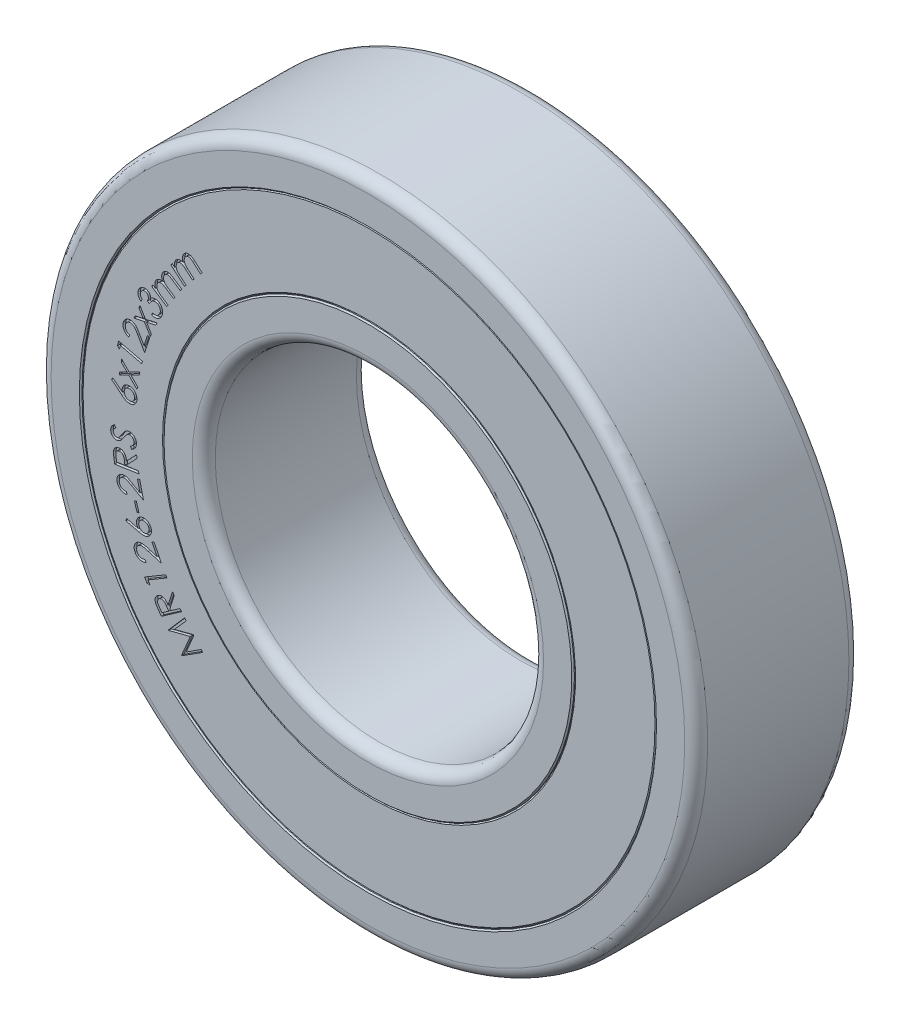
from build123d import *

# Parameters (mm, degrees)
SKETCH_R_INNER_BODY_W          = 3
SKETCH_R_INNER_BODY_H          = 0.75
FILLET_INNER_BODY_R            = 0.21
CHAMFER_INNER_BODY_SIZE        = 0.024
SKETCH_R_OUTER_BODY_W          = 3
SKETCH_R_OUTER_BODY_H          = 0.75
FILLET_OUTER_BODY_R            = 0.21
CHAMFER_OUTER_BODY_SIZE        = 0.024
SKETCH_R_SEAL_FACES_W          = 2.96
SKETCH_R_SEAL_FACES_H          = 1.5
CHAMFER_SEALS_SIZE             = 0.024
CUT_EXTRUDE_SEAL_LABEL_1_DEPTH = 0.05
CUT_EXTRUDE_SEAL_LABEL_2_DEPTH = 0.05


with BuildPart() as part:
    # Sketch R, INNER BODY → Revolve INNER BODY (revolve)
    with BuildSketch(Plane(origin=(0, 0, 0), x_dir=(0, 0, -1), z_dir=(1, 0, 0))):
        with Locations((0, 3.375)):
            Rectangle(SKETCH_R_INNER_BODY_W, SKETCH_R_INNER_BODY_H)
    revolve(axis=Axis((0, 0, 17.5), (0, 0, -1)))

    # Fillet INNER BODY
    fillet_inner_body_edges = [part.edges().sort_by_distance(p)[0] for p in [
        (0, -3, 1.5),
        (0, -3, -1.5),
    ]]
    fillet(fillet_inner_body_edges, radius=FILLET_INNER_BODY_R)

    # Chamfer INNER BODY
    chamfer_inner_body_edges = [part.edges().sort_by_distance(p)[0] for p in [
        (0, -3.75, -1.5),
        (0, -3.75, 1.5),
    ]]
    chamfer(chamfer_inner_body_edges, length=CHAMFER_INNER_BODY_SIZE)


with BuildPart() as body_2:
    # Sketch R, OUTER BODY → Revolve OUTER BODY (revolve)
    with BuildSketch(Plane(origin=(0, 0, 0), x_dir=(0, 0, -1), z_dir=(1, 0, 0))):
        with Locations((0, 5.625)):
            Rectangle(SKETCH_R_OUTER_BODY_W, SKETCH_R_OUTER_BODY_H)
    revolve(axis=Axis((0, 0, 17.5), (0, 0, -1)))

    # Fillet OUTER BODY
    fillet_outer_body_edges = [body_2.edges().sort_by_distance(p)[0] for p in [
        (0, -6, -1.5),
        (0, -6, 1.5),
    ]]
    fillet(fillet_outer_body_edges, radius=FILLET_OUTER_BODY_R)

    # Chamfer OUTER BODY
    chamfer_outer_body_edges = [body_2.edges().sort_by_distance(p)[0] for p in [
        (0, -5.25, 1.5),
        (0, -5.25, -1.5),
    ]]
    chamfer(chamfer_outer_body_edges, length=CHAMFER_OUTER_BODY_SIZE)


with BuildPart() as body_3:
    # Sketch R, SEAL FACES → Revolve SEALS (revolve)
    with BuildSketch(Plane(origin=(0, 0, 0), x_dir=(0, 0, -1), z_dir=(1, 0, 0))):
        with Locations((0, 4.5)):
            Rectangle(SKETCH_R_SEAL_FACES_W, SKETCH_R_SEAL_FACES_H)
    revolve(axis=Axis((0, 0, 17.5), (0, 0, -1)))

    # Chamfer SEALS
    chamfer_seals_edges = [body_3.edges().sort_by_distance(p)[0] for p in [
        (0, -3.75, -1.48),
        (0, -5.25, -1.48),
        (0, -5.25, 1.48),
        (0, -3.75, 1.48),
    ]]
    chamfer(chamfer_seals_edges, length=CHAMFER_SEALS_SIZE)

    # Sketch TEXT RADIUS 1 — MANUALLY ASSIGN TEXT AND FONT SIZE (FROM EQUATIONS) → Cut-Extrude SEAL LABEL 1 (cut)
    # profile 1 of 17: a face of its own
    with BuildSketch(Plane.XY.offset(1.48)):
        with BuildLine():
            Line((-3.622198413, 2.84059165), (-3.594704423, 2.872682996))
            Line((-3.594704423, 2.872682996), (-3.551254904, 2.835453429))
            add(Edge.make_bspline(
                [(-3.551254904, 2.835453429), (-3.552643324, 2.841474529), (-3.555306115, 2.853022138), (-3.55760797, 2.869934305), (-3.558205227, 2.885634898), (-3.557163307, 2.895584851), (-3.556663558, 2.900357275)],
                knots=[0, 0, 0, 0, 1.131226897, 2.169531465, 3.122028821, 4, 4, 4, 4], degree=3))
            add(Edge.make_bspline(
                [(-3.556663558, 2.900357275), (-3.555457977, 2.906386563), (-3.55309039, 2.918227228), (-3.54653843, 2.934959517), (-3.538256221, 2.950629137), (-3.530943596, 2.959833911), (-3.527276538, 2.964449823)],
                knots=[0, 0, 0, 0, 1.032116414, 2.026929808, 3.010565894, 4, 4, 4, 4], degree=3))
            add(Edge.make_bspline(
                [(-3.527276538, 2.964449823), (-3.524598198, 2.967389713), (-3.519293142, 2.973212828), (-3.510398558, 2.980926302), (-3.500738223, 2.987522168), (-3.490556399, 2.993186687), (-3.479996061, 2.997646726), (-3.469400787, 3.000944852), (-3.458877421, 3.002952897), (-3.448223851, 3.003722484), (-3.437081777, 3.003027811), (-3.425134899, 3.000866101), (-3.412196762, 2.997325497), (-3.403423161, 2.994031986), (-3.398821009, 2.99230439)],
                knots=[0, 0, 0, 0, 1.009862006, 2.00025918, 2.982857364, 3.977248327, 4.955655674, 5.890218734, 6.791606427, 7.671695011, 8.597013276, 9.619949959, 10.751556021, 12, 12, 12, 12], degree=3))
            add(Edge.make_bspline(
                [(-3.398821009, 2.99230439), (-3.401191068, 2.999074943), (-3.4058087, 3.012266145), (-3.409630519, 3.032444051), (-3.410994572, 3.052069109), (-3.409843742, 3.068027991), (-3.407689898, 3.080356852), (-3.4054211, 3.089262747), (-3.402627086, 3.097921857), (-3.399172087, 3.106227579), (-3.395361386, 3.114358576), (-3.390641543, 3.12200346), (-3.385591198, 3.129510772), (-3.381733059, 3.134190937), (-3.379800577, 3.13653516)],
                knots=[0, 0, 0, 0, 1.685805421, 3.284488188, 4.814785178, 6.303241273, 7.03551093, 7.757400084, 8.463892392, 9.174159647, 9.872969369, 10.573778959, 11.285627829, 12, 12, 12, 12], degree=3))
            add(Edge.make_bspline(
                [(-3.379800577, 3.13653516), (-3.376002367, 3.140643537), (-3.368580607, 3.148671369), (-3.355783191, 3.158639838), (-3.341946098, 3.166261865), (-3.327269438, 3.171709319), (-3.312013859, 3.1748583), (-3.296379303, 3.175741405), (-3.280584927, 3.173914086), (-3.26736714, 3.170507121), (-3.256524558, 3.166464465), (-3.24783343, 3.162392751), (-3.238691476, 3.157361832), (-3.229021247, 3.151490606), (-3.218889597, 3.144655308), (-3.208300061, 3.136834165), (-3.19723838, 3.128113222), (-3.189817672, 3.121834616), (-3.185990481, 3.118596458)],
                knots=[0, 0, 0, 0, 1.210361762, 2.365065181, 3.495282246, 4.619562822, 5.742750381, 6.857155213, 7.996274776, 9.172221874, 9.804434506, 10.500332021, 11.248777986, 12.063550018, 12.94980688, 13.89480946, 14.914259091, 16, 16, 16, 16], degree=3))
            Line((-3.185990481, 3.118596458), (-3.048790961, 3.001048381))
            Line((-3.048790961, 3.001048381), (-3.077006106, 2.968055592))
            Line((-3.077006106, 2.968055592), (-3.214205625, 3.085603669))
            add(Edge.make_bspline(
                [(-3.214205625, 3.085603669), (-3.21747498, 3.088344987), (-3.223739767, 3.093597943), (-3.232856492, 3.101053758), (-3.241380358, 3.107583375), (-3.249231064, 3.113347076), (-3.256507221, 3.118089418), (-3.263132178, 3.122044678), (-3.269135234, 3.125094809), (-3.276186776, 3.128142971), (-3.284753303, 3.130486061), (-3.295134019, 3.131586444), (-3.305652367, 3.131008977), (-3.316219277, 3.128867144), (-3.326527322, 3.124953683), (-3.336374791, 3.119370267), (-3.345657762, 3.11211538), (-3.351065494, 3.10621038), (-3.353839038, 3.103181794)],
                knots=[0, 0, 0, 0, 1.263930676, 2.421963282, 3.488419228, 4.444559733, 5.306200511, 6.060351277, 6.7291392, 7.299521344, 8.333957623, 9.34546726, 10.379405541, 11.44255014, 12.527092577, 13.631184415, 14.7850701, 16, 16, 16, 16], degree=3))
            add(Edge.make_bspline(
                [(-3.353839038, 3.103181794), (-3.35697571, 3.099184808), (-3.363195877, 3.091258596), (-3.370178159, 3.077812453), (-3.374897474, 3.063375862), (-3.377379597, 3.048204823), (-3.377657785, 3.032716653), (-3.375663222, 3.01734316), (-3.371356558, 3.002274246), (-3.365808942, 2.990034375), (-3.359972914, 2.980097636), (-3.354218474, 2.972117405), (-3.347349672, 2.963524756), (-3.339202283, 2.954458398), (-3.329869107, 2.944821671), (-3.319451236, 2.934524027), (-3.307690473, 2.923833392), (-3.299377096, 2.916625836), (-3.295065, 2.912887323)],
                knots=[0, 0, 0, 0, 1.078730141, 2.139172483, 3.202114919, 4.296796774, 5.396094576, 6.485166477, 7.581507097, 8.716985262, 9.33291152, 10.029717373, 10.807156496, 11.67164311, 12.620725529, 13.660047527, 14.786281385, 16, 16, 16, 16], degree=3))
            Line((-3.295065, 2.912887323), (-3.1966275, 2.828512323))
            Line((-3.1966275, 2.828512323), (-3.22412149, 2.796420977))
            Line((-3.22412149, 2.796420977), (-3.352757308, 2.906667371))
            add(Edge.make_bspline(
                [(-3.352757308, 2.906667371), (-3.35640691, 2.90978192), (-3.363405011, 2.915754057), (-3.373705796, 2.924014757), (-3.383138228, 2.93142127), (-3.391807124, 2.937893877), (-3.399795095, 2.943284187), (-3.40702877, 2.94770687), (-3.413411743, 2.951313059), (-3.420926544, 2.954653078), (-3.429920062, 2.957388495), (-3.440741514, 2.958972604), (-3.451675769, 2.958795925), (-3.462590857, 2.956772578), (-3.473217388, 2.953097184), (-3.48330789, 2.947683933), (-3.492702042, 2.940480179), (-3.498153412, 2.934579204), (-3.500954423, 2.931547179)],
                knots=[0, 0, 0, 0, 1.335965156, 2.561708424, 3.676443336, 4.675519812, 5.573630255, 6.358595934, 7.036397817, 7.613255346, 8.645522205, 9.643055812, 10.64726968, 11.676309901, 12.721551161, 13.765988337, 14.852125343, 16, 16, 16, 16], degree=3))
            add(Edge.make_bspline(
                [(-3.500954423, 2.931547179), (-3.503938166, 2.927727326), (-3.509905653, 2.920087619), (-3.516548351, 2.907040242), (-3.521200743, 2.892934125), (-3.523755855, 2.877990023), (-3.524246343, 2.862625746), (-3.52237518, 2.8473011), (-3.518411814, 2.832217142), (-3.513105576, 2.819954202), (-3.507476674, 2.810213239), (-3.502287648, 2.802402636), (-3.496088041, 2.794216132), (-3.48871708, 2.785805846), (-3.480512905, 2.77690515), (-3.471194691, 2.767760573), (-3.460924214, 2.758190278), (-3.453618453, 2.751837614), (-3.449842644, 2.74855439)],
                knots=[0, 0, 0, 0, 1.082863687, 2.165727374, 3.256747088, 4.396687685, 5.547212769, 6.685048505, 7.840007379, 9.026873145, 9.662515861, 10.356400447, 11.124445163, 11.958956926, 12.858369345, 13.83326568, 14.880174932, 16, 16, 16, 16], degree=3))
            Line((-3.449842644, 2.74855439), (-3.343382308, 2.657328429))
            Line((-3.343382308, 2.657328429), (-3.370876298, 2.625237083))
            Line((-3.370876298, 2.625237083), (-3.622198413, 2.84059165))
        make_face()
    # profile 2 of 17: a face of its own
    with BuildSketch(Plane.XY.offset(1.48)):
        with BuildLine():
            Line((-3.971629978, 2.325063836), (-3.948372766, 2.36031023))
            Line((-3.948372766, 2.36031023), (-3.900686468, 2.328759749))
            add(Edge.make_bspline(
                [(-3.900686468, 2.328759749), (-3.902828286, 2.334557442), (-3.906931165, 2.345663537), (-3.911268342, 2.36212465), (-3.913936594, 2.377558017), (-3.914059109, 2.387524181), (-3.914117959, 2.392311432)],
                knots=[0, 0, 0, 0, 1.134130488, 2.172547028, 3.122182166, 4, 4, 4, 4], degree=3))
            add(Edge.make_bspline(
                [(-3.914117959, 2.392311432), (-3.913668944, 2.398438802), (-3.912785028, 2.410500956), (-3.908333546, 2.427924239), (-3.902055096, 2.444496136), (-3.895978597, 2.454531147), (-3.892934064, 2.459559028)],
                knots=[0, 0, 0, 0, 1.031488593, 2.030557184, 3.013242159, 4, 4, 4, 4], degree=3))
            add(Edge.make_bspline(
                [(-3.892934064, 2.459559028), (-3.890656302, 2.462795232), (-3.886136232, 2.469217266), (-3.878205986, 2.477923541), (-3.869431765, 2.485662996), (-3.860001669, 2.492521004), (-3.850098444, 2.498215512), (-3.839988568, 2.502791685), (-3.829821415, 2.506172837), (-3.81934145, 2.508217689), (-3.808232998, 2.508896617), (-3.796141927, 2.508337671), (-3.782915021, 2.506258504), (-3.773838675, 2.50406791), (-3.769075891, 2.502918403)],
                knots=[0, 0, 0, 0, 1.006296549, 1.99692937, 2.988152204, 3.979257063, 4.958970216, 5.889843987, 6.799015937, 7.67927223, 8.598866478, 9.624498946, 10.753463448, 12, 12, 12, 12], degree=3))
            add(Edge.make_bspline(
                [(-3.769075891, 2.502918403), (-3.77224393, 2.509369456), (-3.778409963, 2.521925303), (-3.784720896, 2.541460278), (-3.788423966, 2.560782953), (-3.78943959, 2.579832887), (-3.787834124, 2.598345012), (-3.783713451, 2.616051503), (-3.777281114, 2.632953978), (-3.77104296, 2.643236954), (-3.767904016, 2.648411192)],
                knots=[0, 0, 0, 0, 1.126652621, 2.19283248, 3.210124564, 4.206414252, 5.176779854, 6.115844831, 7.051921716, 8, 8, 8, 8], degree=3))
            add(Edge.make_bspline(
                [(-3.767904016, 2.648411192), (-3.764668784, 2.652965062), (-3.758339799, 2.661873659), (-3.746801714, 2.673204795), (-3.734112709, 2.682585141), (-3.720192911, 2.6897777), (-3.705404045, 2.694844413), (-3.689987045, 2.697616861), (-3.674089586, 2.697804949), (-3.66052935, 2.696090571), (-3.649279487, 2.693335345), (-3.640145963, 2.690437665), (-3.630468832, 2.686600605), (-3.620214475, 2.681868905), (-3.609296314, 2.676397537), (-3.597880996, 2.669948987), (-3.585838192, 2.662733494), (-3.577742297, 2.657453457), (-3.573553055, 2.654721288)],
                knots=[0, 0, 0, 0, 1.209107132, 2.365339032, 3.488504411, 4.619032666, 5.747983176, 6.866149784, 7.999845657, 9.181994191, 9.818753635, 10.508955219, 11.257785666, 12.074053349, 12.956813598, 13.904671436, 14.915766901, 16, 16, 16, 16], degree=3))
            Line((-3.573553055, 2.654721288), (-3.422922045, 2.555021769))
            Line((-3.422922045, 2.555021769), (-3.446900411, 2.518783788))
            Line((-3.446900411, 2.518783788), (-3.59753142, 2.618483307))
            add(Edge.make_bspline(
                [(-3.59753142, 2.618483307), (-3.601093619, 2.620818355), (-3.607927333, 2.625297905), (-3.617949412, 2.631388755), (-3.627171664, 2.636857023), (-3.63565022, 2.641546775), (-3.64346323, 2.645352476), (-3.650494374, 2.648433918), (-3.656787456, 2.650848573), (-3.664195131, 2.652865095), (-3.672986487, 2.654201884), (-3.683396849, 2.653992136), (-3.693748172, 2.652169005), (-3.7038771, 2.648613537), (-3.713690547, 2.643582751), (-3.722770557, 2.636809262), (-3.731066044, 2.628444972), (-3.735692268, 2.621921208), (-3.738066276, 2.618573451)],
                knots=[0, 0, 0, 0, 1.263601383, 2.424090069, 3.479074803, 4.444571111, 5.297804537, 6.05636361, 6.722068132, 7.295197716, 8.33156115, 9.348024679, 10.371073886, 11.436777009, 12.521330513, 13.630376321, 14.783996118, 16, 16, 16, 16], degree=3))
            add(Edge.make_bspline(
                [(-3.738066276, 2.618573451), (-3.740673942, 2.614229249), (-3.745859979, 2.605589646), (-3.75106782, 2.591369344), (-3.753978754, 2.576461538), (-3.754565317, 2.561115353), (-3.752977337, 2.545709166), (-3.749045307, 2.53071003), (-3.742935667, 2.516306147), (-3.735947676, 2.504857876), (-3.728894607, 2.495758859), (-3.722191613, 2.488538689), (-3.714320767, 2.480855506), (-3.705180849, 2.472813511), (-3.694683203, 2.464513154), (-3.683062017, 2.455609758), (-3.670057883, 2.446490858), (-3.660941692, 2.440315031), (-3.656215314, 2.437113115)],
                knots=[0, 0, 0, 0, 1.076317871, 2.140544581, 3.202713847, 4.297058087, 5.396527652, 6.486829287, 7.584214336, 8.7148521, 9.330070622, 10.031612176, 10.809356907, 11.670147146, 12.620838468, 13.656737815, 14.785113124, 16, 16, 16, 16], degree=3))
            Line((-3.656215314, 2.437113115), (-3.548222526, 2.36562874))
            Line((-3.548222526, 2.36562874), (-3.571569882, 2.330382346))
            Line((-3.571569882, 2.330382346), (-3.712825891, 2.423861913))
            add(Edge.make_bspline(
                [(-3.712825891, 2.423861913), (-3.716840063, 2.426495368), (-3.724521598, 2.431534759), (-3.735731612, 2.438458494), (-3.745971452, 2.444626793), (-3.755392354, 2.449864994), (-3.763920017, 2.454343485), (-3.771659531, 2.457805071), (-3.778437912, 2.460627737), (-3.786289317, 2.463005718), (-3.795528578, 2.464561008), (-3.806456725, 2.464960904), (-3.817242002, 2.463206678), (-3.827842034, 2.459994562), (-3.837947684, 2.455042253), (-3.847241695, 2.448352438), (-3.85566753, 2.4400409), (-3.860335281, 2.433523624), (-3.862735747, 2.430172009)],
                knots=[0, 0, 0, 0, 1.338462757, 2.561287409, 3.673342668, 4.670954362, 5.56646454, 6.357567117, 7.034294382, 7.612050215, 8.640902164, 9.638162029, 10.646445542, 11.671983619, 12.717314488, 13.768136562, 14.852228194, 16, 16, 16, 16], degree=3))
            add(Edge.make_bspline(
                [(-3.862735747, 2.430172009), (-3.865258102, 2.426009322), (-3.870273822, 2.417731791), (-3.87517907, 2.403926628), (-3.878109103, 2.389385721), (-3.87875835, 2.374227209), (-3.877387286, 2.358941824), (-3.873599612, 2.343980772), (-3.867693229, 2.329564549), (-3.860962365, 2.318023661), (-3.854192564, 2.309015702), (-3.847988129, 2.301995329), (-3.840876063, 2.294628556), (-3.832522551, 2.287261088), (-3.823311411, 2.27941043), (-3.812951822, 2.271468782), (-3.801598151, 2.263248318), (-3.793582925, 2.257880669), (-3.789448487, 2.255111913)],
                knots=[0, 0, 0, 0, 1.087989448, 2.16347442, 3.261868347, 4.400790967, 5.550228679, 6.688195994, 7.844512273, 9.030219224, 9.669725891, 10.366313351, 11.127972007, 11.962071958, 12.86018597, 13.839079786, 14.885347853, 16, 16, 16, 16], degree=3))
            Line((-3.789448487, 2.255111913), (-3.67253142, 2.177768163))
            Line((-3.67253142, 2.177768163), (-3.695788632, 2.142521769))
            Line((-3.695788632, 2.142521769), (-3.971629978, 2.325063836))
        make_face()
    # profile 3 of 17: a face of its own
    with BuildSketch(Plane.XY.offset(1.48)):
        with BuildLine():
            Line((-4.146346209, 2.030475871), (-4.167800536, 1.989910967))
            add(Edge.make_bspline(
                [(-4.167800536, 1.989910967), (-4.171270711, 1.992989036), (-4.178080807, 1.999029639), (-4.187354832, 2.008729697), (-4.195722125, 2.018587008), (-4.202831683, 2.028893934), (-4.209115798, 2.039276042), (-4.214198044, 2.050045519), (-4.218240974, 2.061033577), (-4.221331011, 2.072213261), (-4.223333952, 2.083502973), (-4.224173784, 2.094761086), (-4.224250394, 2.105953144), (-4.223122831, 2.117023897), (-4.221066439, 2.128050434), (-4.217830096, 2.138927359), (-4.213847371, 2.149842817), (-4.210330012, 2.156829504), (-4.208545729, 2.160373708)],
                knots=[0, 0, 0, 0, 1.166571328, 2.289355877, 3.373450421, 4.415778458, 5.436134617, 6.423556789, 7.406599354, 8.378621276, 9.338127181, 10.286127948, 11.215989889, 12.15026663, 13.081387694, 14.033629154, 15.002500362, 16, 16, 16, 16], degree=3))
            add(Edge.make_bspline(
                [(-4.208545729, 2.160373708), (-4.205688284, 2.165376714), (-4.200014176, 2.175311324), (-4.189486648, 2.188796664), (-4.177333694, 2.200678181), (-4.163990764, 2.211088061), (-4.149684233, 2.219759807), (-4.134668937, 2.226172589), (-4.119302892, 2.230638192), (-4.103620805, 2.232637493), (-4.08811422, 2.232630759), (-4.073093504, 2.230790855), (-4.058745519, 2.226859581), (-4.049897606, 2.222619428), (-4.045474815, 2.22049991)],
                knots=[0, 0, 0, 0, 1.074863911, 2.134387428, 3.1818526, 4.241376118, 5.288330206, 6.296214704, 7.281975043, 8.266776783, 9.23747516, 10.17075393, 11.085617918, 12, 12, 12, 12], degree=3))
            add(Edge.make_bspline(
                [(-4.045474815, 2.22049991), (-4.041375556, 2.218146284), (-4.033306992, 2.213513646), (-4.022629793, 2.204769343), (-4.013445803, 2.194795463), (-4.005849199, 2.183539051), (-3.999780133, 2.171021059), (-3.995153368, 2.157315299), (-3.992200339, 2.142307311), (-3.991427123, 2.131870737), (-3.9910277, 2.126479477)],
                knots=[0, 0, 0, 0, 0.992041948, 1.952634325, 2.886729312, 3.832512211, 4.795550693, 5.801998863, 6.864570141, 8, 8, 8, 8], degree=3))
            add(Edge.make_bspline(
                [(-3.9910277, 2.126479477), (-3.986544406, 2.130025946), (-3.97770608, 2.137017426), (-3.963152001, 2.145290531), (-3.947955049, 2.151683482), (-3.937374767, 2.154290021), (-3.932073373, 2.155596063)],
                knots=[0, 0, 0, 0, 1.031598182, 2.033683708, 3.014750466, 4, 4, 4, 4], degree=3))
            add(Edge.make_bspline(
                [(-3.932073373, 2.155596063), (-3.928327204, 2.156293318), (-3.920963212, 2.15766394), (-3.909853441, 2.158559309), (-3.898972926, 2.158422502), (-3.88825757, 2.157579633), (-3.877750566, 2.15567051), (-3.867453678, 2.152741989), (-3.857300187, 2.148984536), (-3.850797253, 2.14576914), (-3.847518084, 2.144147746)],
                knots=[0, 0, 0, 0, 1.049521926, 2.06308672, 3.06501777, 4.045576445, 5.0216851, 6.002103925, 6.992541483, 8, 8, 8, 8], degree=3))
            add(Edge.make_bspline(
                [(-3.847518084, 2.144147746), (-3.842038599, 2.140993419), (-3.831129259, 2.134713337), (-3.816508455, 2.122553703), (-3.803434129, 2.108460598), (-3.793978547, 2.095207742), (-3.78742989, 2.083817946), (-3.782944013, 2.075083477), (-3.779271939, 2.066084838), (-3.776318513, 2.056904094), (-3.773821318, 2.047627705), (-3.772136256, 2.038093915), (-3.77105815, 2.028397226), (-3.770462687, 2.015271088), (-3.771265727, 1.998739879), (-3.774933056, 1.979051419), (-3.781185389, 1.959537008), (-3.787205903, 1.947116894), (-3.790276498, 1.940782362)],
                knots=[0, 0, 0, 0, 1.287415149, 2.563169433, 3.859594505, 5.199488771, 5.872141727, 6.538062373, 7.200336126, 7.851431339, 8.503909166, 9.157766684, 9.823630942, 10.492252646, 11.835910805, 13.188023713, 14.565830054, 16, 16, 16, 16], degree=3))
            add(Edge.make_bspline(
                [(-3.790276498, 1.940782362), (-3.792579078, 1.936622025), (-3.797090781, 1.92847021), (-3.804967665, 1.917172044), (-3.813253636, 1.906752647), (-3.822405005, 1.897526847), (-3.832019292, 1.889136898), (-3.842450012, 1.881965463), (-3.853430014, 1.875666823), (-3.865040892, 1.870434018), (-3.877249274, 1.866393094), (-3.889948305, 1.8634492), (-3.903125528, 1.861919195), (-3.91675091, 1.861321948), (-3.930871795, 1.862080072), (-3.945433471, 1.864140978), (-3.960523164, 1.867150156), (-3.970555484, 1.870118596), (-3.975703181, 1.871641737)],
                knots=[0, 0, 0, 0, 1.048451723, 2.054349121, 3.034867404, 3.981865813, 4.917400595, 5.846145459, 6.769598556, 7.707291979, 8.650709865, 9.602799949, 10.578059519, 11.573304529, 12.608891327, 13.692755406, 14.816126682, 16, 16, 16, 16], degree=3))
            Line((-3.975703181, 1.871641737), (-3.955150296, 1.910584044))
            add(Edge.make_bspline(
                [(-3.955150296, 1.910584044), (-3.951580139, 1.90983608), (-3.944615802, 1.908377018), (-3.934369077, 1.906695934), (-3.924607342, 1.905853383), (-3.915396756, 1.9053882), (-3.90672263, 1.905811462), (-3.898538435, 1.9066381), (-3.890876414, 1.908261054), (-3.88602822, 1.909822987), (-3.883665921, 1.910584044)],
                knots=[0, 0, 0, 0, 1.208768825, 2.357956135, 3.437937388, 4.454355905, 5.411079769, 6.312745648, 7.17787973, 8, 8, 8, 8], degree=3))
            add(Edge.make_bspline(
                [(-3.883665921, 1.910584044), (-3.88081665, 1.911762797), (-3.875144647, 1.914109322), (-3.867077935, 1.9185782), (-3.859462473, 1.923825159), (-3.852352748, 1.929909713), (-3.845616396, 1.936667634), (-3.839506094, 1.944352192), (-3.833693382, 1.952676823), (-3.830367037, 1.958718196), (-3.82867794, 1.961785967)],
                knots=[0, 0, 0, 0, 0.962242666, 1.915522927, 2.873317853, 3.84525579, 4.833853782, 5.847905475, 6.907180158, 8, 8, 8, 8], degree=3))
            add(Edge.make_bspline(
                [(-3.82867794, 1.961785967), (-3.82689897, 1.965332018), (-3.823404704, 1.972297196), (-3.81939757, 1.983033905), (-3.816356903, 1.993637818), (-3.814466758, 2.004115778), (-3.813586299, 2.014508113), (-3.814021772, 2.024775845), (-3.815301271, 2.034980243), (-3.817919787, 2.044897098), (-3.821169833, 2.05452429), (-3.825351093, 2.063515852), (-3.830111776, 2.071888367), (-3.835669877, 2.079513577), (-3.841920706, 2.086491302), (-3.848879388, 2.092826901), (-3.856594901, 2.09847021), (-3.862177588, 2.101624261), (-3.865006065, 2.103222265)],
                knots=[0, 0, 0, 0, 1.167342916, 2.292903391, 3.368394681, 4.411335332, 5.423038543, 6.432224256, 7.431942252, 8.444727995, 9.446362322, 10.420182342, 11.359513699, 12.277947815, 13.192667276, 14.11331449, 15.044107815, 16, 16, 16, 16], degree=3))
            add(Edge.make_bspline(
                [(-3.865006065, 2.103222265), (-3.868924691, 2.105085414), (-3.876707367, 2.108785762), (-3.889252639, 2.112206478), (-3.902252573, 2.113716472), (-3.915533612, 2.113424895), (-3.928716175, 2.111411224), (-3.941425992, 2.107456491), (-3.953499406, 2.10175956), (-3.962946739, 2.09541461), (-3.970360903, 2.089371676), (-3.975996689, 2.083799446), (-3.981917469, 2.077470623), (-3.987886807, 2.070177824), (-3.99403875, 2.062019895), (-4.000336591, 2.052989222), (-4.006832463, 2.043070476), (-4.011090147, 2.036077582), (-4.013293325, 2.032459044)],
                knots=[0, 0, 0, 0, 1.127606995, 2.239509722, 3.365759822, 4.523476599, 5.687121843, 6.82504212, 7.976003052, 9.14948858, 9.777348656, 10.463175654, 11.210256916, 12.032371867, 12.914564116, 13.869214918, 14.897405298, 16, 16, 16, 16], degree=3))
            Line((-4.013293325, 2.032459044), (-4.049801738, 2.05174991))
            add(Edge.make_bspline(
                [(-4.049801738, 2.05174991), (-4.04753558, 2.05627256), (-4.043096005, 2.065132771), (-4.038290094, 2.078964742), (-4.034777771, 2.092707355), (-4.032902877, 2.106316801), (-4.032514204, 2.119348106), (-4.033530865, 2.131408872), (-4.035995228, 2.142329985), (-4.040124386, 2.152012412), (-4.045512102, 2.160490558), (-4.051744167, 2.16803493), (-4.059170527, 2.174346806), (-4.064743307, 2.177639603), (-4.067560152, 2.179303996)],
                knots=[0, 0, 0, 0, 1.26941547, 2.486879983, 3.669406049, 4.827521918, 5.929869243, 6.937763266, 7.860442241, 8.729584373, 9.56721999, 10.376070316, 11.179160357, 12, 12, 12, 12], degree=3))
            add(Edge.make_bspline(
                [(-4.067560152, 2.179303996), (-4.06973086, 2.180379789), (-4.074007029, 2.182499037), (-4.080750272, 2.184709469), (-4.087561093, 2.186310262), (-4.094526815, 2.186990228), (-4.101592011, 2.186993042), (-4.108785626, 2.186269464), (-4.116097985, 2.184726107), (-4.123404278, 2.182359101), (-4.130631608, 2.179444849), (-4.137479054, 2.175693742), (-4.143995618, 2.171422166), (-4.14996923, 2.166331459), (-4.155712093, 2.160814128), (-4.160807957, 2.154398113), (-4.165633777, 2.147459691), (-4.168441992, 2.142460149), (-4.169873854, 2.139910967)],
                knots=[0, 0, 0, 0, 0.951692893, 1.874779284, 2.783608952, 3.698488617, 4.620288054, 5.558680237, 6.536788936, 7.553406704, 8.576119644, 9.596645253, 10.61928991, 11.634601722, 12.679203469, 13.74603046, 14.850739368, 16, 16, 16, 16], degree=3))
            add(Edge.make_bspline(
                [(-4.169873854, 2.139910967), (-4.171872261, 2.135667629), (-4.175780189, 2.127369693), (-4.179250621, 2.114232408), (-4.180340915, 2.100998186), (-4.179379026, 2.08994996), (-4.177352777, 2.081104837), (-4.175054511, 2.074297265), (-4.172054052, 2.067343229), (-4.168358788, 2.060227475), (-4.163892296, 2.052995008), (-4.158734384, 2.045602055), (-4.152871366, 2.038016777), (-4.148564479, 2.033039451), (-4.146346209, 2.030475871)],
                knots=[0, 0, 0, 0, 1.39961574, 2.736977848, 4.034555897, 5.350798434, 6.032615549, 6.742533653, 7.494805701, 8.294061253, 9.136492086, 10.033262254, 10.987028706, 12, 12, 12, 12], degree=3))
        make_face()
    # profile 4 of 17: a face of its own
    with BuildSketch(Plane.XY.offset(1.48)):
        Polygon((-4.295416469, 1.660867243), (-4.274953729, 1.707742243), (-4.127387623, 1.739022291), (-4.204731373, 1.868379262), (-4.184268633, 1.915254262), (-4.085470556, 1.74857758), (-3.875164065, 1.795813156), (-3.895807094, 1.748397291), (-4.06383594, 1.711257868), (-3.976396037, 1.564052339), (-3.996768633, 1.517447772), (-4.105843152, 1.701973012), align=None)
    # profile 5 of 17: a face of its own
    with BuildSketch(Plane.XY.offset(1.48)):
        with BuildLine():
            Line((-4.376836011, 1.353336974), (-4.38981678, 1.312411493))
            add(Edge.make_bspline(
                [(-4.38981678, 1.312411493), (-4.394897043, 1.314315768), (-4.40486136, 1.318050771), (-4.419003905, 1.324899633), (-4.431964534, 1.332915191), (-4.443885673, 1.341809141), (-4.454732232, 1.351739833), (-4.46445977, 1.3626393), (-4.473114242, 1.374559519), (-4.480500686, 1.387371449), (-4.486702052, 1.400729453), (-4.491574819, 1.414412778), (-4.494749647, 1.428340017), (-4.496740964, 1.442424102), (-4.497052442, 1.45669362), (-4.495938708, 1.471147499), (-4.493452843, 1.485803839), (-4.490663211, 1.495457448), (-4.489245866, 1.500362214)],
                knots=[0, 0, 0, 0, 1.098860716, 2.155281432, 3.17748585, 4.18198842, 5.164424436, 6.151808835, 7.136957311, 8.143542364, 9.143181292, 10.117434619, 11.080246227, 12.032490992, 12.9946865, 13.965414571, 14.966276254, 16, 16, 16, 16], degree=3))
            add(Edge.make_bspline(
                [(-4.489245866, 1.500362214), (-4.487626707, 1.505146496), (-4.484463716, 1.514492483), (-4.478221991, 1.52765009), (-4.471149662, 1.539755143), (-4.463034153, 1.550764414), (-4.454041719, 1.560753687), (-4.443909425, 1.569494115), (-4.43299819, 1.577358059), (-4.421079597, 1.583809714), (-4.408801384, 1.589307392), (-4.396223269, 1.593460085), (-4.383629635, 1.596493866), (-4.370934149, 1.598101266), (-4.358193681, 1.598464751), (-4.345384131, 1.597578364), (-4.332501046, 1.595294628), (-4.324053248, 1.592894106), (-4.319774712, 1.59167832)],
                knots=[0, 0, 0, 0, 1.126761937, 2.201104426, 3.244594435, 4.252213395, 5.249462534, 6.238328423, 7.234155129, 8.24603013, 9.258171929, 10.233982155, 11.198870994, 12.145752861, 13.08528742, 14.040214307, 15.007432224, 16, 16, 16, 16], degree=3))
            add(Edge.make_bspline(
                [(-4.319774712, 1.59167832), (-4.313848381, 1.589581234), (-4.30212204, 1.585431762), (-4.285740143, 1.57646523), (-4.270592192, 1.56564039), (-4.259082815, 1.55476343), (-4.250118511, 1.544837138), (-4.243029618, 1.536028358), (-4.235439464, 1.526070136), (-4.227672675, 1.514729095), (-4.219303678, 1.502295135), (-4.210735091, 1.488503564), (-4.201678133, 1.473532207), (-4.195683609, 1.463055806), (-4.192581203, 1.457633849)],
                knots=[0, 0, 0, 0, 1.191778283, 2.358153366, 3.53120479, 4.717756731, 5.355875353, 6.069484674, 6.863532412, 7.732275115, 8.678365984, 9.708701342, 10.81416128, 12, 12, 12, 12], degree=3))
            Line((-4.192581203, 1.457633849), (-4.111721828, 1.31511582))
            Line((-4.111721828, 1.31511582), (-4.049161732, 1.512171108))
            Line((-4.049161732, 1.512171108), (-4.007965818, 1.499100195))
            Line((-4.007965818, 1.499100195), (-4.100003078, 1.209196349))
            Line((-4.100003078, 1.209196349), (-4.224402116, 1.428156685))
            add(Edge.make_bspline(
                [(-4.224402116, 1.428156685), (-4.227423391, 1.433483005), (-4.233228901, 1.443717757), (-4.241798518, 1.458319394), (-4.249801752, 1.471603129), (-4.257335921, 1.483483155), (-4.264424685, 1.493963908), (-4.270818594, 1.503197861), (-4.276915145, 1.510955387), (-4.284082667, 1.519552615), (-4.293334555, 1.528564457), (-4.305286853, 1.53754777), (-4.318195662, 1.544825194), (-4.32741279, 1.548172854), (-4.332034328, 1.549851397)],
                knots=[0, 0, 0, 0, 1.323422595, 2.543013431, 3.658975165, 4.675044364, 5.582822794, 6.393620998, 7.101594776, 7.714417049, 8.811993281, 9.883516346, 10.938779235, 12, 12, 12, 12], degree=3))
            add(Edge.make_bspline(
                [(-4.332034328, 1.549851397), (-4.334994783, 1.550694513), (-4.340855748, 1.552363674), (-4.349835835, 1.553766312), (-4.358774093, 1.554358476), (-4.367656676, 1.553866299), (-4.37648824, 1.552532921), (-4.385258608, 1.550131549), (-4.394012518, 1.546885944), (-4.402615215, 1.542756969), (-4.410834667, 1.537856216), (-4.418456867, 1.532253623), (-4.425340179, 1.525970759), (-4.431627872, 1.519111301), (-4.437094281, 1.511511245), (-4.441919675, 1.503304427), (-4.446083033, 1.494500187), (-4.448227609, 1.488275321), (-4.449311972, 1.485127839)],
                knots=[0, 0, 0, 0, 0.991007225, 1.961947629, 2.922209499, 3.872264924, 4.822566982, 5.794858059, 6.796590375, 7.827241382, 8.865007443, 9.875822256, 10.869663095, 11.863503934, 12.868599345, 13.879831381, 14.927978282, 16, 16, 16, 16], degree=3))
            add(Edge.make_bspline(
                [(-4.449311972, 1.485127839), (-4.450320621, 1.481780727), (-4.452306702, 1.475190092), (-4.453915636, 1.465135238), (-4.454836586, 1.455277357), (-4.454499, 1.445579124), (-4.453347013, 1.436035853), (-4.451203353, 1.426615516), (-4.447877294, 1.417417688), (-4.443779264, 1.40837632), (-4.43860474, 1.399727801), (-4.432557261, 1.391501311), (-4.425575771, 1.383768879), (-4.417571185, 1.376698989), (-4.408804346, 1.369946753), (-4.399007476, 1.363829347), (-4.388275081, 1.358264767), (-4.380703642, 1.355003096), (-4.376836011, 1.353336974)],
                knots=[0, 0, 0, 0, 1.000987472, 1.970995262, 2.91306542, 3.835075686, 4.746402185, 5.665753149, 6.597449252, 7.54556417, 8.507237316, 9.480604715, 10.46849853, 11.487119431, 12.53800582, 13.637303289, 14.793090569, 16, 16, 16, 16], degree=3))
        make_face()
    # profile 6 of 17: a face of its own
    with BuildSketch(Plane.XY.offset(1.48)):
        Polygon((-4.596463749, 1.073194213), (-4.575730576, 1.158650944), (-4.140604374, 1.053362483), (-4.151061105, 1.010183396), (-4.543549086, 1.105195415), (-4.560135624, 1.036866088), align=None)
    # profile 7 of 17: a face of its own
    with BuildSketch(Plane.XY.offset(1.48)):
        Polygon((-4.564444687, 0.624217592), (-4.556061274, 0.67487865), (-4.420213918, 0.74158538), (-4.527395408, 0.848496438), (-4.519011995, 0.899157496), (-4.381632187, 0.761236823), (-4.188723533, 0.859043313), (-4.197197091, 0.807751246), (-4.351524014, 0.730227207), (-4.230099735, 0.608532496), (-4.238483149, 0.558232015), (-4.390015601, 0.710846198), align=None)
    # profile 8 of 17: a face of its own
    with BuildSketch(Plane.XY.offset(1.48)):
        with BuildLine():
            Line((-4.706382225, 0.488614882), (-4.678798091, 0.523049978))
            Line((-4.678798091, 0.523049978), (-4.50725362, 0.384678584))
            add(Edge.make_bspline(
                [(-4.50725362, 0.384678584), (-4.508131694, 0.388753641), (-4.509851822, 0.396736582), (-4.511241327, 0.40858928), (-4.511799812, 0.419990605), (-4.511290331, 0.427378194), (-4.511039677, 0.431012719)],
                knots=[0, 0, 0, 0, 1.070959926, 2.097985307, 3.064252462, 4, 4, 4, 4], degree=3))
            add(Edge.make_bspline(
                [(-4.511039677, 0.431012719), (-4.510487419, 0.435352679), (-4.509396687, 0.443924269), (-4.506418898, 0.456382666), (-4.50222875, 0.468216955), (-4.496903397, 0.479438318), (-4.49037393, 0.490046925), (-4.482656496, 0.499978431), (-4.473863504, 0.509328951), (-4.463995904, 0.517900473), (-4.453351548, 0.525603053), (-4.4421489, 0.53223569), (-4.430457997, 0.537590453), (-4.418299361, 0.541648151), (-4.405710091, 0.544539186), (-4.392704499, 0.546256705), (-4.379237556, 0.546720694), (-4.370171657, 0.546088715), (-4.365546889, 0.545766324)],
                knots=[0, 0, 0, 0, 1.016485482, 2.007598565, 2.97082534, 3.930016709, 4.889614926, 5.860636129, 6.848914531, 7.868730522, 8.894295361, 9.899389128, 10.890231417, 11.877596062, 12.873913677, 13.888477363, 14.922853221, 16, 16, 16, 16], degree=3))
            add(Edge.make_bspline(
                [(-4.365546889, 0.545766324), (-4.359261516, 0.54498346), (-4.346908413, 0.543444841), (-4.329198088, 0.53809296), (-4.312524025, 0.530964475), (-4.297276439, 0.521355592), (-4.283351045, 0.510053614), (-4.271126545, 0.496834357), (-4.260835483, 0.481828247), (-4.252395316, 0.465374465), (-4.246053639, 0.447887067), (-4.241820976, 0.429805242), (-4.240028431, 0.41123299), (-4.240772175, 0.398800802), (-4.24114785, 0.392521132)],
                knots=[0, 0, 0, 0, 1.034664369, 2.03350164, 3.015437303, 3.993636427, 4.97190968, 5.942605026, 6.928618594, 7.940093104, 8.960383333, 9.964566631, 10.971874341, 12, 12, 12, 12], degree=3))
            add(Edge.make_bspline(
                [(-4.24114785, 0.392521132), (-4.241947598, 0.386509135), (-4.243533303, 0.374588814), (-4.248745717, 0.357375734), (-4.25585986, 0.340961865), (-4.265269841, 0.325690439), (-4.276472027, 0.311753524), (-4.289405293, 0.299446191), (-4.304170511, 0.289286223), (-4.320230974, 0.280907232), (-4.337343679, 0.274712341), (-4.354997093, 0.270756686), (-4.373033134, 0.268880457), (-4.385077459, 0.269634886), (-4.39114785, 0.270015122)],
                knots=[0, 0, 0, 0, 1.011078911, 2.004722714, 2.990803607, 3.990506885, 4.989379165, 5.96878979, 6.959605854, 7.971493305, 8.985504759, 9.98828678, 10.986087815, 12, 12, 12, 12], degree=3))
            add(Edge.make_bspline(
                [(-4.39114785, 0.270015122), (-4.395764214, 0.270572505), (-4.405182926, 0.271709727), (-4.419215927, 0.275426778), (-4.433584893, 0.28014819), (-4.445560458, 0.285450637), (-4.455439926, 0.29039456), (-4.463175722, 0.294879649), (-4.471328092, 0.299812643), (-4.479730593, 0.305455491), (-4.488647657, 0.311429218), (-4.497689928, 0.318265395), (-4.507173925, 0.325543997), (-4.513543781, 0.330669228), (-4.516808908, 0.333296372)],
                knots=[0, 0, 0, 0, 1.170820783, 2.38881198, 3.651123305, 4.980899164, 5.685492341, 6.435216724, 7.234140031, 8.08707262, 8.986273675, 9.939159052, 10.943632857, 12, 12, 12, 12], degree=3))
            Line((-4.516808908, 0.333296372), (-4.706382225, 0.488614882))
        make_face()
        with BuildLine():
            add(Edge.make_bspline(
                [(-4.472818524, 0.416589642), (-4.473073404, 0.413405924), (-4.473578244, 0.40709995), (-4.473026045, 0.397742003), (-4.471835073, 0.388604248), (-4.469528198, 0.379805057), (-4.466471079, 0.371240871), (-4.462436904, 0.362989623), (-4.457597623, 0.354957052), (-4.451821389, 0.347376161), (-4.445491135, 0.340255609), (-4.438556503, 0.333959328), (-4.431148672, 0.328480904), (-4.423350415, 0.323781371), (-4.415036795, 0.320003871), (-4.406351043, 0.316870682), (-4.3971463, 0.314728124), (-4.390826164, 0.313948683), (-4.387632225, 0.313554786)],
                knots=[0, 0, 0, 0, 1.02934322, 2.038815484, 3.017797314, 3.998362134, 4.967500822, 5.947490305, 6.956776319, 7.988354419, 9.018154131, 10.027067542, 11.004367644, 11.987039148, 12.958744711, 13.946139822, 14.962063046, 16, 16, 16, 16], degree=3))
            add(Edge.make_bspline(
                [(-4.387632225, 0.313554786), (-4.384448508, 0.313299906), (-4.378142533, 0.312795066), (-4.368784587, 0.313347265), (-4.35964683, 0.314538235), (-4.350847647, 0.316845117), (-4.34228343, 0.319902211), (-4.3340323, 0.323936478), (-4.325999271, 0.328775404), (-4.318420135, 0.334553001), (-4.311293063, 0.34087819), (-4.305008312, 0.347844525), (-4.299451187, 0.355181442), (-4.294714219, 0.362951398), (-4.290955789, 0.371247005), (-4.287854407, 0.37987948), (-4.285657422, 0.389010972), (-4.284895725, 0.395275478), (-4.284507225, 0.398470651)],
                knots=[0, 0, 0, 0, 1.030720055, 2.041542574, 3.021833876, 4.003710285, 4.974145279, 5.955445582, 6.966081602, 7.999039526, 9.030216683, 10.040479602, 11.024896446, 12.000561889, 12.973567191, 13.962283027, 14.960674716, 16, 16, 16, 16], degree=3))
            add(Edge.make_bspline(
                [(-4.284507225, 0.398470651), (-4.284304853, 0.401653666), (-4.283903999, 0.407958476), (-4.284219116, 0.41733264), (-4.285659475, 0.426429101), (-4.287731467, 0.435291856), (-4.290981243, 0.443796797), (-4.29496768, 0.452074277), (-4.299821151, 0.460102577), (-4.30559473, 0.467683019), (-4.311920998, 0.474809741), (-4.318887051, 0.481094583), (-4.326224041, 0.486651685), (-4.333993978, 0.491388659), (-4.34228959, 0.495147088), (-4.350922063, 0.49824847), (-4.360053556, 0.500445455), (-4.366318062, 0.501207152), (-4.369513235, 0.501595651)],
                knots=[0, 0, 0, 0, 1.030122961, 2.040433572, 3.022028367, 4.001460792, 4.975151808, 5.95636253, 6.966906291, 7.999769918, 9.030852941, 10.041023635, 11.025350614, 12.00092699, 12.973843468, 13.962469046, 14.960769594, 16, 16, 16, 16], degree=3))
            add(Edge.make_bspline(
                [(-4.369513235, 0.501595651), (-4.372727093, 0.501851632), (-4.379063404, 0.502356314), (-4.388479794, 0.501795926), (-4.397651343, 0.50062564), (-4.406502302, 0.498287518), (-4.415106833, 0.495264584), (-4.423410637, 0.491227012), (-4.431389221, 0.486270231), (-4.438999108, 0.48051344), (-4.446124414, 0.474181861), (-4.452398295, 0.467210894), (-4.457989788, 0.459910233), (-4.462565679, 0.45205419), (-4.466514471, 0.443861029), (-4.469435263, 0.435156449), (-4.471678442, 0.426053197), (-4.472433441, 0.419786124), (-4.472818524, 0.416589642)],
                knots=[0, 0, 0, 0, 1.038502407, 2.047468751, 3.035557672, 4.01563106, 4.993402227, 5.972900567, 6.986741286, 8.017802388, 9.047085993, 10.055493766, 11.038102924, 12.006998234, 12.982317336, 13.966024889, 14.96258323, 16, 16, 16, 16], degree=3))
        make_face(mode=Mode.SUBTRACT)
    # profile 9 of 17: a face of its own
    with BuildSketch(Plane.XY.offset(1.48)):
        with BuildLine():
            Line((-4.336194226, -0.437461475), (-4.36143461, -0.400862918))
            add(Edge.make_bspline(
                [(-4.36143461, -0.400862918), (-4.355805953, -0.397174528), (-4.345028537, -0.390112219), (-4.330658209, -0.378431583), (-4.31850283, -0.366628277), (-4.308721052, -0.354493051), (-4.301274973, -0.342064209), (-4.296248225, -0.329345496), (-4.293301811, -0.316383119), (-4.293471489, -0.307667864), (-4.293556005, -0.30332686)],
                knots=[0, 0, 0, 0, 1.293318448, 2.476368918, 3.555026664, 4.545842336, 5.465444258, 6.329182548, 7.167778378, 8, 8, 8, 8], degree=3))
            add(Edge.make_bspline(
                [(-4.293556005, -0.30332686), (-4.293905745, -0.29961468), (-4.294599137, -0.292254952), (-4.297413336, -0.281548846), (-4.301388561, -0.271286148), (-4.306597523, -0.261597536), (-4.312832882, -0.252754823), (-4.319941811, -0.244953811), (-4.327890373, -0.238387498), (-4.336725936, -0.233298684), (-4.34591975, -0.229322065), (-4.355442922, -0.226692666), (-4.365146603, -0.225239242), (-4.3716768, -0.225434387), (-4.374956245, -0.225532389)],
                knots=[0, 0, 0, 0, 1.070231927, 2.121830136, 3.169198976, 4.228008228, 5.275234608, 6.271648668, 7.253696873, 8.225435979, 9.192827925, 10.12535303, 11.058557863, 12, 12, 12, 12], degree=3))
            add(Edge.make_bspline(
                [(-4.374956245, -0.225532389), (-4.378681126, -0.225934819), (-4.386224678, -0.226749813), (-4.397191041, -0.230592325), (-4.408014442, -0.236005018), (-4.414628323, -0.240927854), (-4.418045187, -0.243471091)],
                knots=[0, 0, 0, 0, 0.946025402, 1.915871401, 2.923297082, 4, 4, 4, 4], degree=3))
            add(Edge.make_bspline(
                [(-4.418045187, -0.243471091), (-4.420505392, -0.245544997), (-4.425663241, -0.249892966), (-4.433235333, -0.257347809), (-4.441015183, -0.265949423), (-4.449265366, -0.275532266), (-4.457831141, -0.28622502), (-4.466486245, -0.298181659), (-4.475669279, -0.311080776), (-4.481712495, -0.320166274), (-4.484842062, -0.324871331)],
                knots=[0, 0, 0, 0, 0.730658842, 1.531834963, 2.411017252, 3.364493588, 4.403734664, 5.521724881, 6.716589296, 8, 8, 8, 8], degree=3))
            add(Edge.make_bspline(
                [(-4.484842062, -0.324871331), (-4.487950864, -0.329539772), (-4.493896371, -0.338468049), (-4.502651692, -0.351061743), (-4.510661236, -0.362362255), (-4.518005575, -0.372290213), (-4.524817225, -0.380790252), (-4.530871022, -0.388015411), (-4.536347815, -0.393832701), (-4.539931891, -0.397065955), (-4.541542783, -0.398519168)],
                knots=[0, 0, 0, 0, 1.444900669, 2.763336707, 3.951158411, 5.013217411, 5.944093445, 6.756853384, 7.441257704, 8, 8, 8, 8], degree=3))
            add(Edge.make_bspline(
                [(-4.541542783, -0.398519168), (-4.544067194, -0.400571576), (-4.549043425, -0.404617375), (-4.55692445, -0.409931899), (-4.564962446, -0.414554811), (-4.573213192, -0.418466338), (-4.581717918, -0.421636283), (-4.590439781, -0.424038512), (-4.599356299, -0.425820311), (-4.605387611, -0.426367943), (-4.608429803, -0.426644168)],
                knots=[0, 0, 0, 0, 1.057217719, 2.084034512, 3.086018941, 4.069161612, 5.048950249, 6.032481054, 7.007584015, 8, 8, 8, 8], degree=3))
            add(Edge.make_bspline(
                [(-4.608429803, -0.426644168), (-4.61321282, -0.426816781), (-4.622637428, -0.427156902), (-4.636572886, -0.425191409), (-4.649995151, -0.421738647), (-4.662759157, -0.416366453), (-4.674627284, -0.40937427), (-4.685412702, -0.400769777), (-4.695007358, -0.390689733), (-4.703371458, -0.379241149), (-4.710301511, -0.366714732), (-4.715416675, -0.353314907), (-4.719082955, -0.339318085), (-4.720009517, -0.329670435), (-4.720479082, -0.324781187)],
                knots=[0, 0, 0, 0, 1.018262253, 2.00641597, 2.986568648, 3.965402411, 4.947290004, 5.913429997, 6.896340379, 7.904401942, 8.927626212, 9.937313813, 10.954669448, 12, 12, 12, 12], degree=3))
            add(Edge.make_bspline(
                [(-4.720479082, -0.324781187), (-4.720611528, -0.31957894), (-4.720874354, -0.309255646), (-4.718924973, -0.293866796), (-4.714915372, -0.278905559), (-4.709917791, -0.266796307), (-4.704799473, -0.257202595), (-4.699994361, -0.249868277), (-4.694422372, -0.242345593), (-4.688189865, -0.234569516), (-4.680844906, -0.226887747), (-4.672979484, -0.218788276), (-4.664098522, -0.210743542), (-4.657870797, -0.205386033), (-4.654673793, -0.202635754)],
                knots=[0, 0, 0, 0, 1.293033951, 2.565885629, 3.842221666, 5.135838732, 5.814674124, 6.544431716, 7.314309021, 8.143101407, 9.020992045, 9.956460237, 10.950948188, 12, 12, 12, 12], degree=3))
            Line((-4.654673793, -0.202635754), (-4.624655764, -0.237341283))
            add(Edge.make_bspline(
                [(-4.624655764, -0.237341283), (-4.627195253, -0.239547726), (-4.632126139, -0.243831941), (-4.639002018, -0.250305424), (-4.645273099, -0.256420227), (-4.650775848, -0.26231203), (-4.655666204, -0.267865057), (-4.659828409, -0.273186255), (-4.663293078, -0.278228933), (-4.666864732, -0.284566951), (-4.670301115, -0.292487427), (-4.673003989, -0.302285348), (-4.674439002, -0.312419964), (-4.674243823, -0.319248577), (-4.674144947, -0.32270787)],
                knots=[0, 0, 0, 0, 1.176930671, 2.285228148, 3.303720627, 4.240883269, 5.10528183, 5.891817352, 6.603314931, 7.243593704, 8.434945738, 9.613378076, 10.790965961, 12, 12, 12, 12], degree=3))
            add(Edge.make_bspline(
                [(-4.674144947, -0.32270787), (-4.673668916, -0.327033789), (-4.672752322, -0.33536331), (-4.668875176, -0.347120187), (-4.662947963, -0.35745276), (-4.65514947, -0.366212481), (-4.646002595, -0.37318503), (-4.635764492, -0.377962856), (-4.6247016, -0.380617318), (-4.617097492, -0.380533302), (-4.613207447, -0.380490322)],
                knots=[0, 0, 0, 0, 1.110776783, 2.13879108, 3.140647258, 4.136916751, 5.119095549, 6.061125723, 7.008127233, 8, 8, 8, 8], degree=3))
            add(Edge.make_bspline(
                [(-4.613207447, -0.380490322), (-4.610794414, -0.380280393), (-4.605981976, -0.379861722), (-4.598898641, -0.378143722), (-4.591972855, -0.375832584), (-4.585104595, -0.372695675), (-4.578258842, -0.368468713), (-4.571316259, -0.362957812), (-4.564086921, -0.356290887), (-4.55946993, -0.351173825), (-4.557047591, -0.34848912)],
                knots=[0, 0, 0, 0, 0.872534394, 1.740140892, 2.620982773, 3.503623176, 4.457209641, 5.515208521, 6.696335635, 8, 8, 8, 8], degree=3))
            add(Edge.make_bspline(
                [(-4.557047591, -0.34848912), (-4.556227059, -0.347474524), (-4.55428382, -0.345071694), (-4.551174023, -0.340686195), (-4.547165214, -0.335118003), (-4.542511323, -0.328131486), (-4.537026209, -0.319859632), (-4.530723949, -0.310299021), (-4.523567545, -0.299494036), (-4.518635332, -0.291795447), (-4.516031966, -0.287731908)],
                knots=[0, 0, 0, 0, 0.426986971, 1.011218209, 1.758910435, 2.67268658, 3.758291274, 5.007562934, 6.420504862, 8, 8, 8, 8], degree=3))
            add(Edge.make_bspline(
                [(-4.516031966, -0.287731908), (-4.512841453, -0.282847825), (-4.506641994, -0.273357603), (-4.497233781, -0.259843642), (-4.487894757, -0.247576395), (-4.47892166, -0.236385405), (-4.470182366, -0.226330196), (-4.461623968, -0.217464512), (-4.453255839, -0.209782762), (-4.442572256, -0.201237252), (-4.429207664, -0.192428358), (-4.412695361, -0.184568759), (-4.396018541, -0.178983448), (-4.38464119, -0.177740053), (-4.379012735, -0.177124937)],
                knots=[0, 0, 0, 0, 1.148920014, 2.232457238, 3.242043064, 4.184737677, 5.057084745, 5.864792428, 6.610386816, 7.29244885, 8.557942713, 9.751708964, 10.887754832, 12, 12, 12, 12], degree=3))
            add(Edge.make_bspline(
                [(-4.379012735, -0.177124937), (-4.375015255, -0.176980923), (-4.367096943, -0.176695657), (-4.355342903, -0.177740186), (-4.343918429, -0.179886504), (-4.332841383, -0.183274636), (-4.322047238, -0.187760851), (-4.311680283, -0.193643299), (-4.301496051, -0.200474032), (-4.291914559, -0.20856263), (-4.282909555, -0.217386105), (-4.274965255, -0.226981277), (-4.268068958, -0.237116075), (-4.262271279, -0.247807079), (-4.257549854, -0.259067123), (-4.253936262, -0.270900055), (-4.251494357, -0.283353596), (-4.250694224, -0.291869124), (-4.250286774, -0.296205466)],
                knots=[0, 0, 0, 0, 0.985349998, 1.95180651, 2.901971735, 3.846372975, 4.802554424, 5.777490771, 6.780148061, 7.821571154, 8.863968611, 9.884527066, 10.887184356, 11.881598229, 12.877666243, 13.892319778, 14.926710971, 16, 16, 16, 16], degree=3))
            add(Edge.make_bspline(
                [(-4.250286774, -0.296205466), (-4.250153148, -0.299570379), (-4.249888243, -0.306241115), (-4.250257201, -0.316183669), (-4.251314961, -0.325921334), (-4.253177387, -0.335454276), (-4.255556142, -0.344817125), (-4.258751434, -0.353970566), (-4.26263514, -0.362921494), (-4.267262717, -0.371677936), (-4.272599762, -0.380353981), (-4.278963777, -0.388807239), (-4.286198883, -0.397200138), (-4.294342886, -0.405527049), (-4.303476479, -0.413694593), (-4.313473663, -0.421814992), (-4.324457489, -0.429773204), (-4.332206333, -0.434849165), (-4.336194226, -0.437461475)],
                knots=[0, 0, 0, 0, 0.925450754, 1.83465024, 2.732218985, 3.615111131, 4.502627798, 5.385558582, 6.277102028, 7.182315592, 8.106032219, 9.074108747, 10.087397845, 11.150468573, 12.273402058, 13.453771755, 14.689599948, 16, 16, 16, 16], degree=3))
        make_face()
    # profile 10 of 17: a face of its own
    with BuildSketch(Plane.XY.offset(1.48)):
        with BuildLine():
            Line((-4.64817789, -0.826041969), (-4.661429092, -0.737700623))
            add(Edge.make_bspline(
                [(-4.661429092, -0.737700623), (-4.662278094, -0.731782276), (-4.663901912, -0.72046273), (-4.666109693, -0.704214941), (-4.667805957, -0.689393723), (-4.669180905, -0.67605589), (-4.670125943, -0.664154218), (-4.670557324, -0.653721087), (-4.670719344, -0.644728649), (-4.670467591, -0.639232634), (-4.67035337, -0.636739084)],
                knots=[0, 0, 0, 0, 1.413748003, 2.703962112, 3.876972415, 4.940965263, 5.874425399, 6.699368232, 7.409901658, 8, 8, 8, 8], degree=3))
            add(Edge.make_bspline(
                [(-4.67035337, -0.636739084), (-4.670019549, -0.633395523), (-4.669360024, -0.626789699), (-4.667394947, -0.617133389), (-4.664918505, -0.607758054), (-4.661572405, -0.59882059), (-4.657578875, -0.590202285), (-4.652770136, -0.582043564), (-4.647358192, -0.574147578), (-4.641241799, -0.56669547), (-4.634519592, -0.559749423), (-4.627147691, -0.553526497), (-4.619322365, -0.547847756), (-4.610777068, -0.543158124), (-4.601855464, -0.538913045), (-4.592276814, -0.535633997), (-4.582227883, -0.532884296), (-4.57526366, -0.53169337), (-4.571735582, -0.531090046)],
                knots=[0, 0, 0, 0, 1.027445664, 2.029909171, 3.011197635, 3.991451985, 4.945622115, 5.913773826, 6.88536775, 7.871810527, 8.860008198, 9.838234239, 10.820383634, 11.812465225, 12.816066292, 13.839555789, 14.905518215, 16, 16, 16, 16], degree=3))
            add(Edge.make_bspline(
                [(-4.571735582, -0.531090046), (-4.565854942, -0.530420646), (-4.554349702, -0.529110991), (-4.537249694, -0.529864446), (-4.520946661, -0.532934812), (-4.505521767, -0.538296911), (-4.491139505, -0.545760439), (-4.478049249, -0.555433761), (-4.466575215, -0.567348641), (-4.45814068, -0.57873409), (-4.452181075, -0.58901651), (-4.447982217, -0.597638801), (-4.444098532, -0.607101494), (-4.440495929, -0.617355588), (-4.437294243, -0.628477675), (-4.434298885, -0.64037395), (-4.431709639, -0.653106214), (-4.430242219, -0.661884576), (-4.429487986, -0.666396536)],
                knots=[0, 0, 0, 0, 1.271780613, 2.488188878, 3.666006598, 4.829258557, 5.98871435, 7.139396881, 8.31423053, 9.53475432, 10.177824702, 10.868790846, 11.596287938, 12.377278151, 13.205756863, 14.085320092, 15.015880346, 16, 16, 16, 16], degree=3))
            Line((-4.429487986, -0.666396536), (-4.247216351, -0.476102065))
            Line((-4.247216351, -0.476102065), (-4.239013226, -0.530999902))
            Line((-4.239013226, -0.530999902), (-4.421375005, -0.720933796))
            Line((-4.421375005, -0.720933796), (-4.417588947, -0.746264325))
            Line((-4.417588947, -0.746264325), (-4.211429092, -0.715434998))
            Line((-4.211429092, -0.715434998), (-4.204758419, -0.759785959))
            Line((-4.204758419, -0.759785959), (-4.64817789, -0.826041969))
        make_face()
        with BuildLine():
            Line((-4.611399044, -0.775200623), (-4.46067789, -0.752664565))
            Line((-4.46067789, -0.752664565), (-4.471495197, -0.676312402))
            add(Edge.make_bspline(
                [(-4.471495197, -0.676312402), (-4.472043558, -0.672732913), (-4.473101506, -0.665827029), (-4.474994857, -0.655905098), (-4.477073385, -0.646735353), (-4.479318008, -0.638322087), (-4.481623945, -0.630630509), (-4.484149576, -0.623734731), (-4.486861272, -0.617608873), (-4.490486777, -0.610463654), (-4.495847918, -0.602686476), (-4.503240289, -0.59451113), (-4.511956537, -0.587876191), (-4.521595829, -0.582700729), (-4.531871634, -0.57886194), (-4.542638554, -0.576726612), (-4.553725593, -0.576023926), (-4.561133046, -0.576833749), (-4.56488462, -0.577243892)],
                knots=[0, 0, 0, 0, 1.1199152, 2.16064504, 3.123302508, 4.027244255, 4.853306844, 5.606010183, 6.296724977, 6.92435247, 8.081700085, 9.206348074, 10.319766474, 11.450846764, 12.579901773, 13.698968348, 14.834620833, 16, 16, 16, 16], degree=3))
            add(Edge.make_bspline(
                [(-4.56488462, -0.577243892), (-4.56852417, -0.577901541), (-4.575692214, -0.579196771), (-4.585803343, -0.583276372), (-4.595280506, -0.588461625), (-4.603787219, -0.595169613), (-4.611255491, -0.602847035), (-4.617392002, -0.611452691), (-4.62212261, -0.620792575), (-4.624839484, -0.629276141), (-4.626080234, -0.636684821), (-4.626845016, -0.643028474), (-4.627052526, -0.650170177), (-4.626925719, -0.658075671), (-4.626608981, -0.666770971), (-4.62574208, -0.676205856), (-4.624577125, -0.686426139), (-4.623557672, -0.693472341), (-4.623027649, -0.697135719)],
                knots=[0, 0, 0, 0, 1.164575133, 2.29361525, 3.423053687, 4.565204425, 5.69881678, 6.793675438, 7.88804099, 8.991941627, 9.589177718, 10.257429822, 11.007262661, 11.841971783, 12.753294814, 13.752841958, 14.831684396, 16, 16, 16, 16], degree=3))
            Line((-4.623027649, -0.697135719), (-4.611399044, -0.775200623))
        make_face(mode=Mode.SUBTRACT)
    # profile 11 of 17: a face of its own
    with BuildSketch(Plane.XY.offset(1.48)):
        with BuildLine():
            Line((-4.431948141, -1.153288506), (-4.422032276, -1.195025285))
            add(Edge.make_bspline(
                [(-4.422032276, -1.195025285), (-4.427368018, -1.195988225), (-4.437809381, -1.197872577), (-4.45346859, -1.19910398), (-4.468675483, -1.199073809), (-4.483504775, -1.197530951), (-4.497845007, -1.194552515), (-4.511796408, -1.190176182), (-4.525295898, -1.184411661), (-4.538236253, -1.177298313), (-4.550387194, -1.16904403), (-4.561466025, -1.159739898), (-4.571511904, -1.1496027), (-4.580255223, -1.138421822), (-4.587974067, -1.12640294), (-4.594459697, -1.113430566), (-4.599854258, -1.099585141), (-4.602386385, -1.089886721), (-4.603672901, -1.084959179)],
                knots=[0, 0, 0, 0, 1.099426852, 2.151437254, 3.181709485, 4.180776273, 5.170725116, 6.148264046, 7.14244594, 8.143723569, 9.139642157, 10.117656188, 11.074659162, 12.029601763, 12.991832925, 13.967849978, 14.967511759, 16, 16, 16, 16], degree=3))
            add(Edge.make_bspline(
                [(-4.603672901, -1.084959179), (-4.604733393, -1.080047892), (-4.606814427, -1.070410338), (-4.608192834, -1.055964434), (-4.608320289, -1.041964364), (-4.607099499, -1.028385921), (-4.604339133, -1.015223059), (-4.600307563, -1.002484946), (-4.59481492, -0.990208541), (-4.588084354, -0.978479818), (-4.580297727, -0.96748573), (-4.571712675, -0.957422435), (-4.562395835, -0.948434879), (-4.552320714, -0.94059637), (-4.541636947, -0.933635902), (-4.530149485, -0.927921337), (-4.51800753, -0.923131021), (-4.509529553, -0.920929854), (-4.505235401, -0.919814948)],
                knots=[0, 0, 0, 0, 1.122465342, 2.202644772, 3.237179585, 4.249201448, 5.243885223, 6.238137914, 7.230550719, 8.24457716, 9.256643612, 10.238105604, 11.197808345, 12.145206697, 13.08806916, 14.04341254, 15.008975042, 16, 16, 16, 16], degree=3))
            add(Edge.make_bspline(
                [(-4.505235401, -0.919814948), (-4.49909748, -0.918612667), (-4.486931471, -0.91622962), (-4.468364264, -0.915320929), (-4.449905297, -0.917051222), (-4.43447582, -0.920285329), (-4.421748696, -0.924284343), (-4.411113944, -0.92808689), (-4.399572972, -0.932896753), (-4.387042588, -0.938494415), (-4.373529555, -0.944922861), (-4.359107381, -0.952323918), (-4.343643409, -0.96052691), (-4.333108175, -0.966427899), (-4.327651266, -0.969484419)],
                knots=[0, 0, 0, 0, 1.188921256, 2.356567712, 3.521650233, 4.707929561, 5.348068387, 6.058735859, 6.856032325, 7.726146388, 8.669728133, 9.702652142, 10.810048333, 12, 12, 12, 12], degree=3))
            Line((-4.327651266, -0.969484419), (-4.185223381, -1.050073361))
            Line((-4.185223381, -1.050073361), (-4.232729391, -0.849232015))
            Line((-4.232729391, -0.849232015), (-4.190722179, -0.83931615))
            Line((-4.190722179, -0.83931615), (-4.120860401, -1.134808938))
            Line((-4.120860401, -1.134808938), (-4.339730593, -1.01104091))
            add(Edge.make_bspline(
                [(-4.339730593, -1.01104091), (-4.345043476, -1.008026337), (-4.35524527, -1.002237757), (-4.370013429, -0.994064409), (-4.383748073, -0.986998156), (-4.396262386, -0.980621733), (-4.407693588, -0.975229829), (-4.417984408, -0.970671768), (-4.427155475, -0.967056468), (-4.437738086, -0.963436647), (-4.450270751, -0.960461769), (-4.465102679, -0.958779044), (-4.479932686, -0.959169256), (-4.489568388, -0.961053897), (-4.494418093, -0.962002448)],
                knots=[0, 0, 0, 0, 1.321817643, 2.538152912, 3.651963014, 4.66386892, 5.577133537, 6.386516204, 7.098888611, 7.709553579, 8.805610754, 9.878335147, 10.932153762, 12, 12, 12, 12], degree=3))
            add(Edge.make_bspline(
                [(-4.494418093, -0.962002448), (-4.4974151, -0.962774527), (-4.503300695, -0.964290755), (-4.511694929, -0.967747417), (-4.519603679, -0.971832959), (-4.526985582, -0.976787715), (-4.533880004, -0.982431723), (-4.54007575, -0.989062056), (-4.546010466, -0.996219309), (-4.551144072, -1.004223153), (-4.555645606, -1.01266127), (-4.559353422, -1.021361521), (-4.562107456, -1.030268898), (-4.563782505, -1.039379557), (-4.564706412, -1.048667984), (-4.564714747, -1.058151306), (-4.56370561, -1.067812253), (-4.562354841, -1.074212069), (-4.561665689, -1.077477208)],
                knots=[0, 0, 0, 0, 0.998530143, 1.960937131, 2.924664529, 3.869489121, 4.827579921, 5.795452402, 6.795867455, 7.826886126, 8.860231898, 9.88230397, 10.87700623, 11.864914419, 12.869276268, 13.888348686, 14.922651155, 16, 16, 16, 16], degree=3))
            add(Edge.make_bspline(
                [(-4.561665689, -1.077477208), (-4.560764889, -1.0808615), (-4.558995156, -1.087510359), (-4.555342851, -1.097006396), (-4.551024129, -1.105907113), (-4.545892214, -1.11415755), (-4.539844233, -1.121661185), (-4.533207913, -1.128640033), (-4.525722938, -1.13489883), (-4.517554023, -1.140481029), (-4.508684044, -1.145236996), (-4.499300973, -1.149262546), (-4.489307242, -1.152207099), (-4.478835364, -1.154275952), (-4.467825397, -1.155436115), (-4.456307659, -1.155710668), (-4.444258628, -1.154944115), (-4.436119103, -1.153849449), (-4.431948141, -1.153288506)],
                knots=[0, 0, 0, 0, 1.004201641, 1.972878005, 2.913645757, 3.839361529, 4.753564733, 5.674248856, 6.598156392, 7.54745727, 8.507966156, 9.481502483, 10.471579418, 11.491095885, 12.54025302, 13.644057694, 14.792737235, 16, 16, 16, 16], degree=3))
        make_face()
    # profile 12 of 17: a face of its own
    with BuildSketch(Plane.XY.offset(1.48)):
        Polygon((-4.239777173, -1.385793241), (-4.288004337, -1.226147808), (-4.252667798, -1.215420644), (-4.204440635, -1.375066077), align=None)
    # profile 13 of 17: a face of its own
    with BuildSketch(Plane.XY.offset(1.48)):
        with BuildLine():
            Line((-4.442215397, -1.621652912), (-4.432569964, -1.578744258))
            Line((-4.432569964, -1.578744258), (-4.219108426, -1.627692576))
            add(Edge.make_bspline(
                [(-4.219108426, -1.627692576), (-4.221642106, -1.624386482), (-4.226579099, -1.617944406), (-4.233151546, -1.608015675), (-4.238481145, -1.597989615), (-4.241333203, -1.591176506), (-4.242726214, -1.587848826)],
                knots=[0, 0, 0, 0, 1.074854157, 2.094402884, 3.069262067, 4, 4, 4, 4], degree=3))
            add(Edge.make_bspline(
                [(-4.242726214, -1.587848826), (-4.24413093, -1.583726174), (-4.246895764, -1.575611758), (-4.249567539, -1.563187117), (-4.251071346, -1.550814954), (-4.251170818, -1.538473923), (-4.24982865, -1.526196684), (-4.24744526, -1.513972465), (-4.243589276, -1.501810415), (-4.238468616, -1.489853044), (-4.232317203, -1.478310761), (-4.225184738, -1.467490314), (-4.217019622, -1.457674892), (-4.208053383, -1.448646554), (-4.198075697, -1.440579267), (-4.187104254, -1.433527612), (-4.17536918, -1.427060174), (-4.166956991, -1.423754841), (-4.162678137, -1.422073585)],
                knots=[0, 0, 0, 0, 1.0184803, 2.004625877, 2.967509252, 3.93085465, 4.885202045, 5.853257707, 6.840680951, 7.864608032, 8.893280393, 9.897633119, 10.891569302, 11.876033855, 12.870964422, 13.887063218, 14.925256318, 16, 16, 16, 16], degree=3))
            add(Edge.make_bspline(
                [(-4.162678137, -1.422073585), (-4.156714691, -1.420037442), (-4.145001568, -1.416038146), (-4.126852975, -1.413081653), (-4.108860973, -1.412271102), (-4.091060695, -1.414027003), (-4.07369991, -1.418057553), (-4.057062037, -1.424510569), (-4.04131003, -1.433381205), (-4.026662131, -1.444462843), (-4.013229251, -1.45723134), (-4.001748705, -1.471721953), (-3.991979014, -1.487505591), (-3.98722565, -1.498951655), (-3.98482357, -1.504735845)],
                knots=[0, 0, 0, 0, 1.035691153, 2.034256031, 3.01441061, 3.993341354, 4.968754422, 5.939654837, 6.92068265, 7.934661842, 8.956153207, 9.962685695, 10.970457053, 12, 12, 12, 12], degree=3))
            add(Edge.make_bspline(
                [(-3.98482357, -1.504735845), (-3.982891755, -1.510462348), (-3.979076788, -1.521771103), (-3.97615519, -1.539418409), (-3.975500359, -1.557174639), (-3.977250383, -1.574928089), (-3.981154961, -1.59228554), (-3.987410615, -1.608886074), (-3.99612041, -1.624432234), (-4.006902113, -1.638865106), (-4.019463299, -1.65187056), (-4.033465792, -1.663153418), (-4.048798531, -1.672616112), (-4.059901894, -1.677208842), (-4.065502657, -1.679525508)],
                knots=[0, 0, 0, 0, 1.013448113, 2.00136722, 2.990921284, 3.989502619, 4.988275137, 5.970340297, 6.957331296, 7.97047793, 8.987436699, 9.985023291, 10.983604626, 12, 12, 12, 12], degree=3))
            add(Edge.make_bspline(
                [(-4.065502657, -1.679525508), (-4.06989228, -1.681034515), (-4.07878937, -1.684093038), (-4.092935483, -1.686951554), (-4.107814261, -1.688846691), (-4.120817547, -1.68949503), (-4.131792561, -1.689186923), (-4.140668526, -1.688790969), (-4.150111002, -1.68785866), (-4.160075697, -1.686456916), (-4.170632964, -1.684858829), (-4.181732092, -1.682882649), (-4.19335338, -1.680424337), (-4.201263169, -1.678578392), (-4.205316359, -1.67763248)],
                knots=[0, 0, 0, 0, 1.176157419, 2.383889916, 3.651500899, 4.978958307, 5.680257326, 6.435699432, 7.231940494, 8.085562198, 8.987711397, 9.939972373, 10.944386278, 12, 12, 12, 12], degree=3))
            Line((-4.205316359, -1.67763248), (-4.442215397, -1.621652912))
        make_face()
        with BuildLine():
            add(Edge.make_bspline(
                [(-4.202251455, -1.584152912), (-4.201039425, -1.587090269), (-4.198642298, -1.592899715), (-4.194229513, -1.601097686), (-4.189115016, -1.608666189), (-4.183373993, -1.615639754), (-4.176817281, -1.621866308), (-4.169625984, -1.627497635), (-4.161804048, -1.632553576), (-4.153363444, -1.636835516), (-4.144583468, -1.640342681), (-4.135647115, -1.642950256), (-4.126658858, -1.644737093), (-4.11762064, -1.645370576), (-4.108550336, -1.645401442), (-4.099486396, -1.644083658), (-4.090304822, -1.642197353), (-4.084323205, -1.640112282), (-4.081277897, -1.639050749)],
                knots=[0, 0, 0, 0, 1.031464768, 2.040010941, 3.017049468, 3.994087996, 4.967220306, 5.947178278, 6.956809645, 7.986750046, 9.015996807, 10.022652899, 11.006344796, 11.985281953, 12.961150257, 13.9451809, 14.953868686, 16, 16, 16, 16], degree=3))
            add(Edge.make_bspline(
                [(-4.081277897, -1.639050749), (-4.07834054, -1.63783872), (-4.072531092, -1.635441593), (-4.064333133, -1.631028803), (-4.056764585, -1.625914325), (-4.049791188, -1.620173232), (-4.043564009, -1.61361678), (-4.03793505, -1.6064245), (-4.032869934, -1.59860637), (-4.028618057, -1.59014115), (-4.024977144, -1.581404427), (-4.022385293, -1.572444205), (-4.02064551, -1.563454038), (-4.019805874, -1.554422964), (-4.020014331, -1.54535787), (-4.02111379, -1.536306122), (-4.02306664, -1.527194331), (-4.025142583, -1.521272974), (-4.026199772, -1.51825748)],
                knots=[0, 0, 0, 0, 1.032458644, 2.04197661, 3.01995657, 3.997936531, 4.972006511, 5.952908729, 6.963512935, 7.994445743, 9.028335697, 10.03596176, 11.020601502, 12.001309174, 12.978264279, 13.962031586, 14.96214965, 16, 16, 16, 16], degree=3))
            add(Edge.make_bspline(
                [(-4.026199772, -1.51825748), (-4.027411787, -1.515320106), (-4.029808887, -1.509510627), (-4.034221875, -1.501312896), (-4.039335625, -1.493743513), (-4.045079417, -1.486773211), (-4.051643002, -1.480518112), (-4.058881809, -1.474931141), (-4.066760185, -1.469951332), (-4.075196404, -1.465682596), (-4.083937061, -1.462048369), (-4.092896208, -1.459454115), (-4.101857416, -1.45772304), (-4.110857195, -1.456872247), (-4.119892744, -1.457085152), (-4.128944374, -1.458183219), (-4.138056196, -1.460136445), (-4.143977549, -1.462212336), (-4.146993041, -1.463269499)],
                knots=[0, 0, 0, 0, 1.032928549, 2.042905979, 3.021331049, 3.99975612, 4.97426943, 5.963323801, 6.969132451, 8.000534469, 9.03489498, 10.042979646, 11.028067529, 11.999489242, 12.976888991, 13.961104041, 14.961677291, 16, 16, 16, 16], degree=3))
            add(Edge.make_bspline(
                [(-4.146993041, -1.463269499), (-4.149961778, -1.464478339), (-4.155808283, -1.466858979), (-4.164066644, -1.471308431), (-4.171654812, -1.476471756), (-4.178656091, -1.482268523), (-4.185012041, -1.488766982), (-4.190573851, -1.496072887), (-4.195669839, -1.50389235), (-4.199945428, -1.512339059), (-4.203450127, -1.521117623), (-4.206073462, -1.530053522), (-4.207796184, -1.539017955), (-4.20864917, -1.548016887), (-4.208435676, -1.557052663), (-4.207337769, -1.566104232), (-4.205384499, -1.575216071), (-4.203308614, -1.581137421), (-4.202251455, -1.584152912)],
                knots=[0, 0, 0, 0, 1.039892829, 2.04792139, 3.038001986, 4.014539072, 4.993945544, 5.98109142, 6.990204619, 8.019616428, 9.048334953, 10.054474404, 11.037661446, 12.007208689, 12.982722432, 13.965038326, 14.963680854, 16, 16, 16, 16], degree=3))
        make_face(mode=Mode.SUBTRACT)
    # profile 14 of 17: a face of its own
    with BuildSketch(Plane.XY.offset(1.48)):
        with BuildLine():
            Line((-4.093351825, -2.058437835), (-4.074331392, -2.096929421))
            add(Edge.make_bspline(
                [(-4.074331392, -2.096929421), (-4.079312787, -2.099098681), (-4.08906349, -2.103344843), (-4.104098335, -2.107991002), (-4.118941424, -2.111398065), (-4.13377412, -2.113241434), (-4.148477558, -2.113450686), (-4.163102466, -2.112435253), (-4.177585233, -2.109749154), (-4.191844056, -2.105740973), (-4.205552543, -2.100331593), (-4.218533078, -2.093843701), (-4.23058463, -2.086171614), (-4.241651389, -2.077227669), (-4.251861416, -2.067232721), (-4.261097092, -2.056033301), (-4.269472018, -2.043737689), (-4.274146538, -2.034839945), (-4.276524902, -2.030312835)],
                knots=[0, 0, 0, 0, 1.099034613, 2.151277214, 3.179784172, 4.1786386, 5.170225832, 6.152196787, 7.14122508, 8.14630089, 9.145895786, 10.119695172, 11.079739989, 12.031541601, 12.994971474, 13.9668695, 14.965557247, 16, 16, 16, 16], degree=3))
            add(Edge.make_bspline(
                [(-4.276524902, -2.030312835), (-4.278658008, -2.025752674), (-4.282849876, -2.016791287), (-4.287487596, -2.002967753), (-4.290792138, -1.989306768), (-4.292628023, -1.975743407), (-4.292994648, -1.962294379), (-4.291903607, -1.94893531), (-4.289359925, -1.935698647), (-4.285386562, -1.922737106), (-4.280272914, -1.910249848), (-4.274142202, -1.898511679), (-4.267066332, -1.887602583), (-4.259061676, -1.877577951), (-4.250033918, -1.868514848), (-4.240186605, -1.860281909), (-4.229385738, -1.852891437), (-4.221610302, -1.848778321), (-4.217660719, -1.846689037)],
                knots=[0, 0, 0, 0, 1.121374333, 2.203665733, 3.243340041, 4.25022453, 5.24851869, 6.236333204, 7.231995267, 8.246867154, 9.253060875, 10.23566213, 11.194230748, 12.14712023, 13.089572544, 14.040577167, 15.004698423, 16, 16, 16, 16], degree=3))
            add(Edge.make_bspline(
                [(-4.217660719, -1.846689037), (-4.211952011, -1.84409593), (-4.200613758, -1.838945674), (-4.182615633, -1.834069177), (-4.164210539, -1.831420697), (-4.148409708, -1.831131044), (-4.135062898, -1.832125796), (-4.123849663, -1.833518914), (-4.111482729, -1.835488031), (-4.097985466, -1.838283369), (-4.083286569, -1.841450294), (-4.067519836, -1.845528456), (-4.050560605, -1.84994832), (-4.03895529, -1.853385518), (-4.03295519, -1.855162595)],
                knots=[0, 0, 0, 0, 1.187919381, 2.359365864, 3.52268397, 4.708618408, 5.348707099, 6.06072887, 6.851710249, 7.723727312, 8.6753101, 9.703956052, 10.81291526, 12, 12, 12, 12], degree=3))
            Line((-4.03295519, -1.855162595), (-3.875563363, -1.901767162))
            Line((-3.875563363, -1.901767162), (-3.967240046, -1.716250335))
            Line((-3.967240046, -1.716250335), (-3.928478027, -1.697049614))
            Line((-3.928478027, -1.697049614), (-3.793532113, -1.970006345))
            Line((-3.793532113, -1.970006345), (-4.03529894, -1.89852197))
            add(Edge.make_bspline(
                [(-4.03529894, -1.89852197), (-4.04118361, -1.896762921), (-4.052482132, -1.893385563), (-4.068800348, -1.888788805), (-4.083789395, -1.884794895), (-4.097490838, -1.881441831), (-4.109876272, -1.8787438), (-4.120931219, -1.876625403), (-4.130672573, -1.875149686), (-4.141819147, -1.874053327), (-4.154737032, -1.873938984), (-4.169577246, -1.875753909), (-4.183979588, -1.879390475), (-4.192951332, -1.883421514), (-4.197468411, -1.885451056)],
                knots=[0, 0, 0, 0, 1.325401544, 2.544760758, 3.658325232, 4.672719671, 5.588453772, 6.393474093, 7.101422131, 7.713733943, 8.809600218, 9.880904299, 10.933081008, 12, 12, 12, 12], degree=3))
            add(Edge.make_bspline(
                [(-4.197468411, -1.885451056), (-4.200202182, -1.886902612), (-4.205609485, -1.889773738), (-4.213138062, -1.894931789), (-4.219885591, -1.900821538), (-4.226017916, -1.907286358), (-4.231431034, -1.914418656), (-4.236118159, -1.922240657), (-4.240202213, -1.930642348), (-4.243482812, -1.939590111), (-4.246001731, -1.948816549), (-4.247658936, -1.958136394), (-4.248307451, -1.967476846), (-4.247885254, -1.976769058), (-4.246762421, -1.986050675), (-4.244553969, -1.995287216), (-4.241395024, -2.004518401), (-4.238628357, -2.010503626), (-4.237222017, -2.013546008)],
                knots=[0, 0, 0, 0, 0.995527167, 1.969117665, 2.928779666, 3.872724543, 4.831948019, 5.803712163, 6.80270824, 7.833714534, 8.865808483, 9.87685202, 10.875099084, 11.87179953, 12.866058001, 13.879272401, 14.9220012, 16, 16, 16, 16], degree=3))
            add(Edge.make_bspline(
                [(-4.237222017, -2.013546008), (-4.235595276, -2.016643432), (-4.232386564, -2.022753038), (-4.226695757, -2.031196932), (-4.220422022, -2.038900238), (-4.213472956, -2.045688028), (-4.206032328, -2.051859905), (-4.197884356, -2.057047841), (-4.189171545, -2.061511827), (-4.179895794, -2.065100139), (-4.170177057, -2.067796193), (-4.160093092, -2.06956102), (-4.149669152, -2.070101695), (-4.138952889, -2.069906157), (-4.127962651, -2.068439033), (-4.116644411, -2.066220155), (-4.105016516, -2.062864697), (-4.097298644, -2.059935691), (-4.093351825, -2.058437835)],
                knots=[0, 0, 0, 0, 1.000599757, 1.973662517, 2.908432329, 3.83876178, 4.749328916, 5.670031049, 6.596856723, 7.547004393, 8.510866761, 9.479244807, 10.469967173, 11.493580628, 12.542031595, 13.63820117, 14.792206772, 16, 16, 16, 16], degree=3))
        make_face()
    # profile 15 of 17: a face of its own
    with BuildSketch(Plane.XY.offset(1.48)):
        Polygon((-4.055819849, -2.414622428), (-4.100441244, -2.338901274), (-3.715074657, -2.111827957), (-3.692538599, -2.150049111), (-4.040224897, -2.354856803), (-4.004527782, -2.415343582), align=None)
    # profile 16 of 17: a face of its own
    with BuildSketch(Plane.XY.offset(1.48)):
        with BuildLine():
            Line((-3.796065424, -2.808966799), (-3.847267348, -2.735499251))
            add(Edge.make_bspline(
                [(-3.847267348, -2.735499251), (-3.850668778, -2.730575582), (-3.857182352, -2.721146997), (-3.866429424, -2.707558089), (-3.874522609, -2.69497359), (-3.881743606, -2.683597604), (-3.887906627, -2.67333349), (-3.892949337, -2.664159863), (-3.897179023, -2.656228448), (-3.899368549, -2.651167592), (-3.900362299, -2.648870645)],
                knots=[0, 0, 0, 0, 1.41155851, 2.703065906, 3.876711032, 4.940526039, 5.881327769, 6.699838224, 7.409901607, 8, 8, 8, 8], degree=3))
            add(Edge.make_bspline(
                [(-3.900362299, -2.648870645), (-3.901547192, -2.645700402), (-3.90389128, -2.639428666), (-3.906611849, -2.629889596), (-3.908433076, -2.620324118), (-3.909393128, -2.610792302), (-3.909691934, -2.601270618), (-3.909177767, -2.591759745), (-3.907663383, -2.582280482), (-3.905544572, -2.572830281), (-3.902600074, -2.563581667), (-3.89877399, -2.554689298), (-3.894184369, -2.546192439), (-3.888718138, -2.538127522), (-3.882472378, -2.530438075), (-3.875430356, -2.523161017), (-3.867628522, -2.516209315), (-3.86190938, -2.51207275), (-3.858986098, -2.509958385)],
                knots=[0, 0, 0, 0, 1.031824921, 2.041273427, 3.020705881, 3.997219263, 4.959746163, 5.923449987, 6.896690515, 7.883638124, 8.87470325, 9.851689426, 10.831636108, 11.815174856, 12.818365614, 13.848765502, 14.900417974, 16, 16, 16, 16], degree=3))
            add(Edge.make_bspline(
                [(-3.858986098, -2.509958385), (-3.853984533, -2.506730239), (-3.844220604, -2.500428332), (-3.828550534, -2.49338941), (-3.812524072, -2.488954065), (-3.796280887, -2.486827319), (-3.780023143, -2.48720148), (-3.763935036, -2.48997265), (-3.748299364, -2.495538793), (-3.735684022, -2.502097203), (-3.725706, -2.508627219), (-3.718039418, -2.514487301), (-3.710405598, -2.521342252), (-3.702522614, -2.528860557), (-3.694706296, -2.537433848), (-3.686668319, -2.54675692), (-3.678677537, -2.557066863), (-3.673448152, -2.564299956), (-3.670764944, -2.56801127)],
                knots=[0, 0, 0, 0, 1.275147613, 2.489311628, 3.666395274, 4.829161894, 5.989176315, 7.140588274, 8.314263787, 9.533204904, 10.180102421, 10.869526456, 11.59988353, 12.379052438, 13.204276331, 14.086205496, 15.018028387, 16, 16, 16, 16], degree=3))
            Line((-3.670764944, -2.56801127), (-3.591798598, -2.315787712))
            Line((-3.591798598, -2.315787712), (-3.559977684, -2.361400693))
            Line((-3.559977684, -2.361400693), (-3.639124319, -2.613353818))
            Line((-3.639124319, -2.613353818), (-3.624430809, -2.634447568))
            Line((-3.624430809, -2.634447568), (-3.452976482, -2.514826174))
            Line((-3.452976482, -2.514826174), (-3.427285376, -2.551695164))
            Line((-3.427285376, -2.551695164), (-3.796065424, -2.808966799))
        make_face()
        with BuildLine():
            Line((-3.785698838, -2.746947568), (-3.660308213, -2.65941752))
            Line((-3.660308213, -2.65941752), (-3.704118309, -2.595685549))
            add(Edge.make_bspline(
                [(-3.704118309, -2.595685549), (-3.706199949, -2.592724972), (-3.710217551, -2.587011005), (-3.716407297, -2.578966989), (-3.722305473, -2.571615445), (-3.72796437, -2.56495069), (-3.733583928, -2.559224363), (-3.738891519, -2.554121504), (-3.74403119, -2.549772495), (-3.750538613, -2.545021417), (-3.758774147, -2.540329474), (-3.769090997, -2.536321464), (-3.779867375, -2.534309302), (-3.790840964, -2.533806416), (-3.801755186, -2.535158475), (-3.812454454, -2.537810978), (-3.82270001, -2.542286518), (-3.829017798, -2.546319828), (-3.832213261, -2.548359828)],
                knots=[0, 0, 0, 0, 1.115413307, 2.152767958, 3.127671854, 4.020744313, 4.84602594, 5.599420523, 6.289590022, 6.919455483, 8.080870006, 9.200658252, 10.314108784, 11.444987897, 12.57313303, 13.691809975, 14.832544842, 16, 16, 16, 16], degree=3))
            add(Edge.make_bspline(
                [(-3.832213261, -2.548359828), (-3.835171448, -2.550588304), (-3.840986976, -2.554969285), (-3.848401477, -2.562991318), (-3.85444944, -2.571985654), (-3.859215695, -2.581747599), (-3.862468495, -2.592016165), (-3.864124299, -2.602472707), (-3.864119738, -2.612996426), (-3.862734279, -2.621808211), (-3.860734105, -2.629100494), (-3.85837062, -2.635075075), (-3.855548344, -2.641647166), (-3.851839362, -2.648682087), (-3.847655615, -2.65631706), (-3.842744666, -2.664459762), (-3.837154173, -2.673118463), (-3.833072786, -2.678991079), (-3.830951242, -2.682043722)],
                knots=[0, 0, 0, 0, 1.163490733, 2.287317496, 3.417489133, 4.56336926, 5.693619983, 6.794099367, 7.88134114, 8.991162038, 9.589849931, 10.257096824, 11.010656616, 11.839403613, 12.757685939, 13.749979682, 14.830417751, 16, 16, 16, 16], degree=3))
            Line((-3.830951242, -2.682043722), (-3.785698838, -2.746947568))
        make_face(mode=Mode.SUBTRACT)
    # profile 17 of 17: a face of its own
    with BuildSketch(Plane.XY.offset(1.48)):
        Polygon((-3.039857914, -3.002290057), (-3.42116801, -3.246220346), (-3.42585551, -3.240721548), (-3.265939645, -2.862836932), (-3.662303827, -2.965871788), (-3.667171616, -2.960282846), (-3.369335077, -2.619267221), (-3.340488924, -2.652800875), (-3.554942049, -2.895108567), (-3.208607914, -2.806136211), (-3.201216087, -2.814699913), (-3.341300222, -3.147061692), (-3.068073058, -2.969477557), align=None)
    extrude(amount=-CUT_EXTRUDE_SEAL_LABEL_1_DEPTH, mode=Mode.SUBTRACT)

    # Sketch TEXT RADIUS 2 — MANUALLY ASSIGN TEXT AND FONT SIZE (FROM EQUATIONS) → Cut-Extrude SEAL LABEL 2 (cut)
    # profile 1 of 17: a face of its own
    with BuildSketch(Plane(origin=(0, 0, -1.48), x_dir=(-1, 0, 0), z_dir=(0, 0, -1))):
        with BuildLine():
            Line((-3.622198413, 2.84059165), (-3.594704423, 2.872682996))
            Line((-3.594704423, 2.872682996), (-3.551254904, 2.835453429))
            add(Edge.make_bspline(
                [(-3.551254904, 2.835453429), (-3.552643324, 2.841474529), (-3.555306115, 2.853022138), (-3.55760797, 2.869934305), (-3.558205227, 2.885634898), (-3.557163307, 2.895584851), (-3.556663558, 2.900357275)],
                knots=[0, 0, 0, 0, 1.131226897, 2.169531465, 3.122028821, 4, 4, 4, 4], degree=3))
            add(Edge.make_bspline(
                [(-3.556663558, 2.900357275), (-3.555457977, 2.906386563), (-3.55309039, 2.918227228), (-3.54653843, 2.934959517), (-3.538256221, 2.950629137), (-3.530943596, 2.959833911), (-3.527276538, 2.964449823)],
                knots=[0, 0, 0, 0, 1.032116414, 2.026929808, 3.010565894, 4, 4, 4, 4], degree=3))
            add(Edge.make_bspline(
                [(-3.527276538, 2.964449823), (-3.524598198, 2.967389713), (-3.519293142, 2.973212828), (-3.510398558, 2.980926302), (-3.500738223, 2.987522168), (-3.490556399, 2.993186687), (-3.479996061, 2.997646726), (-3.469400787, 3.000944852), (-3.458877421, 3.002952897), (-3.448223851, 3.003722484), (-3.437081777, 3.003027811), (-3.425134899, 3.000866101), (-3.412196762, 2.997325497), (-3.403423161, 2.994031986), (-3.398821009, 2.99230439)],
                knots=[0, 0, 0, 0, 1.009862006, 2.00025918, 2.982857364, 3.977248327, 4.955655674, 5.890218734, 6.791606427, 7.671695011, 8.597013276, 9.619949959, 10.751556021, 12, 12, 12, 12], degree=3))
            add(Edge.make_bspline(
                [(-3.398821009, 2.99230439), (-3.401191068, 2.999074943), (-3.4058087, 3.012266145), (-3.409630519, 3.032444051), (-3.410994572, 3.052069109), (-3.409843742, 3.068027991), (-3.407689898, 3.080356852), (-3.4054211, 3.089262747), (-3.402627086, 3.097921857), (-3.399172087, 3.106227579), (-3.395361386, 3.114358576), (-3.390641543, 3.12200346), (-3.385591198, 3.129510772), (-3.381733059, 3.134190937), (-3.379800577, 3.13653516)],
                knots=[0, 0, 0, 0, 1.685805421, 3.284488188, 4.814785178, 6.303241273, 7.03551093, 7.757400084, 8.463892392, 9.174159647, 9.872969369, 10.573778959, 11.285627829, 12, 12, 12, 12], degree=3))
            add(Edge.make_bspline(
                [(-3.379800577, 3.13653516), (-3.376002367, 3.140643537), (-3.368580607, 3.148671369), (-3.355783191, 3.158639838), (-3.341946098, 3.166261865), (-3.327269438, 3.171709319), (-3.312013859, 3.1748583), (-3.296379303, 3.175741405), (-3.280584927, 3.173914086), (-3.26736714, 3.170507121), (-3.256524558, 3.166464465), (-3.24783343, 3.162392751), (-3.238691476, 3.157361832), (-3.229021247, 3.151490606), (-3.218889597, 3.144655308), (-3.208300061, 3.136834165), (-3.19723838, 3.128113222), (-3.189817672, 3.121834616), (-3.185990481, 3.118596458)],
                knots=[0, 0, 0, 0, 1.210361762, 2.365065181, 3.495282246, 4.619562822, 5.742750381, 6.857155213, 7.996274776, 9.172221874, 9.804434506, 10.500332021, 11.248777986, 12.063550018, 12.94980688, 13.89480946, 14.914259091, 16, 16, 16, 16], degree=3))
            Line((-3.185990481, 3.118596458), (-3.048790961, 3.001048381))
            Line((-3.048790961, 3.001048381), (-3.077006106, 2.968055592))
            Line((-3.077006106, 2.968055592), (-3.214205625, 3.085603669))
            add(Edge.make_bspline(
                [(-3.214205625, 3.085603669), (-3.21747498, 3.088344987), (-3.223739767, 3.093597943), (-3.232856492, 3.101053758), (-3.241380358, 3.107583375), (-3.249231064, 3.113347076), (-3.256507221, 3.118089418), (-3.263132178, 3.122044678), (-3.269135234, 3.125094809), (-3.276186776, 3.128142971), (-3.284753303, 3.130486061), (-3.295134019, 3.131586444), (-3.305652367, 3.131008977), (-3.316219277, 3.128867144), (-3.326527322, 3.124953683), (-3.336374791, 3.119370267), (-3.345657762, 3.11211538), (-3.351065494, 3.10621038), (-3.353839038, 3.103181794)],
                knots=[0, 0, 0, 0, 1.263930676, 2.421963282, 3.488419228, 4.444559733, 5.306200511, 6.060351277, 6.7291392, 7.299521344, 8.333957623, 9.34546726, 10.379405541, 11.44255014, 12.527092577, 13.631184415, 14.7850701, 16, 16, 16, 16], degree=3))
            add(Edge.make_bspline(
                [(-3.353839038, 3.103181794), (-3.35697571, 3.099184808), (-3.363195877, 3.091258596), (-3.370178159, 3.077812453), (-3.374897474, 3.063375862), (-3.377379597, 3.048204823), (-3.377657785, 3.032716653), (-3.375663222, 3.01734316), (-3.371356558, 3.002274246), (-3.365808942, 2.990034375), (-3.359972914, 2.980097636), (-3.354218474, 2.972117405), (-3.347349672, 2.963524756), (-3.339202283, 2.954458398), (-3.329869107, 2.944821671), (-3.319451236, 2.934524027), (-3.307690473, 2.923833392), (-3.299377096, 2.916625836), (-3.295065, 2.912887323)],
                knots=[0, 0, 0, 0, 1.078730141, 2.139172483, 3.202114919, 4.296796774, 5.396094576, 6.485166477, 7.581507097, 8.716985262, 9.33291152, 10.029717373, 10.807156496, 11.67164311, 12.620725529, 13.660047527, 14.786281385, 16, 16, 16, 16], degree=3))
            Line((-3.295065, 2.912887323), (-3.1966275, 2.828512323))
            Line((-3.1966275, 2.828512323), (-3.22412149, 2.796420977))
            Line((-3.22412149, 2.796420977), (-3.352757308, 2.906667371))
            add(Edge.make_bspline(
                [(-3.352757308, 2.906667371), (-3.35640691, 2.90978192), (-3.363405011, 2.915754057), (-3.373705796, 2.924014757), (-3.383138228, 2.93142127), (-3.391807124, 2.937893877), (-3.399795095, 2.943284187), (-3.40702877, 2.94770687), (-3.413411743, 2.951313059), (-3.420926544, 2.954653078), (-3.429920062, 2.957388495), (-3.440741514, 2.958972604), (-3.451675769, 2.958795925), (-3.462590857, 2.956772578), (-3.473217388, 2.953097184), (-3.48330789, 2.947683933), (-3.492702042, 2.940480179), (-3.498153412, 2.934579204), (-3.500954423, 2.931547179)],
                knots=[0, 0, 0, 0, 1.335965156, 2.561708424, 3.676443336, 4.675519812, 5.573630255, 6.358595934, 7.036397817, 7.613255346, 8.645522205, 9.643055812, 10.64726968, 11.676309901, 12.721551161, 13.765988337, 14.852125343, 16, 16, 16, 16], degree=3))
            add(Edge.make_bspline(
                [(-3.500954423, 2.931547179), (-3.503938166, 2.927727326), (-3.509905653, 2.920087619), (-3.516548351, 2.907040242), (-3.521200743, 2.892934125), (-3.523755855, 2.877990023), (-3.524246343, 2.862625746), (-3.52237518, 2.8473011), (-3.518411814, 2.832217142), (-3.513105576, 2.819954202), (-3.507476674, 2.810213239), (-3.502287648, 2.802402636), (-3.496088041, 2.794216132), (-3.48871708, 2.785805846), (-3.480512905, 2.77690515), (-3.471194691, 2.767760573), (-3.460924214, 2.758190278), (-3.453618453, 2.751837614), (-3.449842644, 2.74855439)],
                knots=[0, 0, 0, 0, 1.082863687, 2.165727374, 3.256747088, 4.396687685, 5.547212769, 6.685048505, 7.840007379, 9.026873145, 9.662515861, 10.356400447, 11.124445163, 11.958956926, 12.858369345, 13.83326568, 14.880174932, 16, 16, 16, 16], degree=3))
            Line((-3.449842644, 2.74855439), (-3.343382308, 2.657328429))
            Line((-3.343382308, 2.657328429), (-3.370876298, 2.625237083))
            Line((-3.370876298, 2.625237083), (-3.622198413, 2.84059165))
        make_face()
    # profile 2 of 17: a face of its own
    with BuildSketch(Plane(origin=(0, 0, -1.48), x_dir=(-1, 0, 0), z_dir=(0, 0, -1))):
        with BuildLine():
            Line((-3.971629978, 2.325063836), (-3.948372766, 2.36031023))
            Line((-3.948372766, 2.36031023), (-3.900686468, 2.328759749))
            add(Edge.make_bspline(
                [(-3.900686468, 2.328759749), (-3.902828286, 2.334557442), (-3.906931165, 2.345663537), (-3.911268342, 2.36212465), (-3.913936594, 2.377558017), (-3.914059109, 2.387524181), (-3.914117959, 2.392311432)],
                knots=[0, 0, 0, 0, 1.134130488, 2.172547028, 3.122182166, 4, 4, 4, 4], degree=3))
            add(Edge.make_bspline(
                [(-3.914117959, 2.392311432), (-3.913668944, 2.398438802), (-3.912785028, 2.410500956), (-3.908333546, 2.427924239), (-3.902055096, 2.444496136), (-3.895978597, 2.454531147), (-3.892934064, 2.459559028)],
                knots=[0, 0, 0, 0, 1.031488593, 2.030557184, 3.013242159, 4, 4, 4, 4], degree=3))
            add(Edge.make_bspline(
                [(-3.892934064, 2.459559028), (-3.890656302, 2.462795232), (-3.886136232, 2.469217266), (-3.878205986, 2.477923541), (-3.869431765, 2.485662996), (-3.860001669, 2.492521004), (-3.850098444, 2.498215512), (-3.839988568, 2.502791685), (-3.829821415, 2.506172837), (-3.81934145, 2.508217689), (-3.808232998, 2.508896617), (-3.796141927, 2.508337671), (-3.782915021, 2.506258504), (-3.773838675, 2.50406791), (-3.769075891, 2.502918403)],
                knots=[0, 0, 0, 0, 1.006296549, 1.99692937, 2.988152204, 3.979257063, 4.958970216, 5.889843987, 6.799015937, 7.67927223, 8.598866478, 9.624498946, 10.753463448, 12, 12, 12, 12], degree=3))
            add(Edge.make_bspline(
                [(-3.769075891, 2.502918403), (-3.77224393, 2.509369456), (-3.778409963, 2.521925303), (-3.784720896, 2.541460278), (-3.788423966, 2.560782953), (-3.78943959, 2.579832887), (-3.787834124, 2.598345012), (-3.783713451, 2.616051503), (-3.777281114, 2.632953978), (-3.77104296, 2.643236954), (-3.767904016, 2.648411192)],
                knots=[0, 0, 0, 0, 1.126652621, 2.19283248, 3.210124564, 4.206414252, 5.176779854, 6.115844831, 7.051921716, 8, 8, 8, 8], degree=3))
            add(Edge.make_bspline(
                [(-3.767904016, 2.648411192), (-3.764668784, 2.652965062), (-3.758339799, 2.661873659), (-3.746801714, 2.673204795), (-3.734112709, 2.682585141), (-3.720192911, 2.6897777), (-3.705404045, 2.694844413), (-3.689987045, 2.697616861), (-3.674089586, 2.697804949), (-3.66052935, 2.696090571), (-3.649279487, 2.693335345), (-3.640145963, 2.690437665), (-3.630468832, 2.686600605), (-3.620214475, 2.681868905), (-3.609296314, 2.676397537), (-3.597880996, 2.669948987), (-3.585838192, 2.662733494), (-3.577742297, 2.657453457), (-3.573553055, 2.654721288)],
                knots=[0, 0, 0, 0, 1.209107132, 2.365339032, 3.488504411, 4.619032666, 5.747983176, 6.866149784, 7.999845657, 9.181994191, 9.818753635, 10.508955219, 11.257785666, 12.074053349, 12.956813598, 13.904671436, 14.915766901, 16, 16, 16, 16], degree=3))
            Line((-3.573553055, 2.654721288), (-3.422922045, 2.555021769))
            Line((-3.422922045, 2.555021769), (-3.446900411, 2.518783788))
            Line((-3.446900411, 2.518783788), (-3.59753142, 2.618483307))
            add(Edge.make_bspline(
                [(-3.59753142, 2.618483307), (-3.601093619, 2.620818355), (-3.607927333, 2.625297905), (-3.617949412, 2.631388755), (-3.627171664, 2.636857023), (-3.63565022, 2.641546775), (-3.64346323, 2.645352476), (-3.650494374, 2.648433918), (-3.656787456, 2.650848573), (-3.664195131, 2.652865095), (-3.672986487, 2.654201884), (-3.683396849, 2.653992136), (-3.693748172, 2.652169005), (-3.7038771, 2.648613537), (-3.713690547, 2.643582751), (-3.722770557, 2.636809262), (-3.731066044, 2.628444972), (-3.735692268, 2.621921208), (-3.738066276, 2.618573451)],
                knots=[0, 0, 0, 0, 1.263601383, 2.424090069, 3.479074803, 4.444571111, 5.297804537, 6.05636361, 6.722068132, 7.295197716, 8.33156115, 9.348024679, 10.371073886, 11.436777009, 12.521330513, 13.630376321, 14.783996118, 16, 16, 16, 16], degree=3))
            add(Edge.make_bspline(
                [(-3.738066276, 2.618573451), (-3.740673942, 2.614229249), (-3.745859979, 2.605589646), (-3.75106782, 2.591369344), (-3.753978754, 2.576461538), (-3.754565317, 2.561115353), (-3.752977337, 2.545709166), (-3.749045307, 2.53071003), (-3.742935667, 2.516306147), (-3.735947676, 2.504857876), (-3.728894607, 2.495758859), (-3.722191613, 2.488538689), (-3.714320767, 2.480855506), (-3.705180849, 2.472813511), (-3.694683203, 2.464513154), (-3.683062017, 2.455609758), (-3.670057883, 2.446490858), (-3.660941692, 2.440315031), (-3.656215314, 2.437113115)],
                knots=[0, 0, 0, 0, 1.076317871, 2.140544581, 3.202713847, 4.297058087, 5.396527652, 6.486829287, 7.584214336, 8.7148521, 9.330070622, 10.031612176, 10.809356907, 11.670147146, 12.620838468, 13.656737815, 14.785113124, 16, 16, 16, 16], degree=3))
            Line((-3.656215314, 2.437113115), (-3.548222526, 2.36562874))
            Line((-3.548222526, 2.36562874), (-3.571569882, 2.330382346))
            Line((-3.571569882, 2.330382346), (-3.712825891, 2.423861913))
            add(Edge.make_bspline(
                [(-3.712825891, 2.423861913), (-3.716840063, 2.426495368), (-3.724521598, 2.431534759), (-3.735731612, 2.438458494), (-3.745971452, 2.444626793), (-3.755392354, 2.449864994), (-3.763920017, 2.454343485), (-3.771659531, 2.457805071), (-3.778437912, 2.460627737), (-3.786289317, 2.463005718), (-3.795528578, 2.464561008), (-3.806456725, 2.464960904), (-3.817242002, 2.463206678), (-3.827842034, 2.459994562), (-3.837947684, 2.455042253), (-3.847241695, 2.448352438), (-3.85566753, 2.4400409), (-3.860335281, 2.433523624), (-3.862735747, 2.430172009)],
                knots=[0, 0, 0, 0, 1.338462757, 2.561287409, 3.673342668, 4.670954362, 5.56646454, 6.357567117, 7.034294382, 7.612050215, 8.640902164, 9.638162029, 10.646445542, 11.671983619, 12.717314488, 13.768136562, 14.852228194, 16, 16, 16, 16], degree=3))
            add(Edge.make_bspline(
                [(-3.862735747, 2.430172009), (-3.865258102, 2.426009322), (-3.870273822, 2.417731791), (-3.87517907, 2.403926628), (-3.878109103, 2.389385721), (-3.87875835, 2.374227209), (-3.877387286, 2.358941824), (-3.873599612, 2.343980772), (-3.867693229, 2.329564549), (-3.860962365, 2.318023661), (-3.854192564, 2.309015702), (-3.847988129, 2.301995329), (-3.840876063, 2.294628556), (-3.832522551, 2.287261088), (-3.823311411, 2.27941043), (-3.812951822, 2.271468782), (-3.801598151, 2.263248318), (-3.793582925, 2.257880669), (-3.789448487, 2.255111913)],
                knots=[0, 0, 0, 0, 1.087989448, 2.16347442, 3.261868347, 4.400790967, 5.550228679, 6.688195994, 7.844512273, 9.030219224, 9.669725891, 10.366313351, 11.127972007, 11.962071958, 12.86018597, 13.839079786, 14.885347853, 16, 16, 16, 16], degree=3))
            Line((-3.789448487, 2.255111913), (-3.67253142, 2.177768163))
            Line((-3.67253142, 2.177768163), (-3.695788632, 2.142521769))
            Line((-3.695788632, 2.142521769), (-3.971629978, 2.325063836))
        make_face()
    # profile 3 of 17: a face of its own
    with BuildSketch(Plane(origin=(0, 0, -1.48), x_dir=(-1, 0, 0), z_dir=(0, 0, -1))):
        with BuildLine():
            Line((-4.146346209, 2.030475871), (-4.167800536, 1.989910967))
            add(Edge.make_bspline(
                [(-4.167800536, 1.989910967), (-4.171270711, 1.992989036), (-4.178080807, 1.999029639), (-4.187354832, 2.008729697), (-4.195722125, 2.018587008), (-4.202831683, 2.028893934), (-4.209115798, 2.039276042), (-4.214198044, 2.050045519), (-4.218240974, 2.061033577), (-4.221331011, 2.072213261), (-4.223333952, 2.083502973), (-4.224173784, 2.094761086), (-4.224250394, 2.105953144), (-4.223122831, 2.117023897), (-4.221066439, 2.128050434), (-4.217830096, 2.138927359), (-4.213847371, 2.149842817), (-4.210330012, 2.156829504), (-4.208545729, 2.160373708)],
                knots=[0, 0, 0, 0, 1.166571328, 2.289355877, 3.373450421, 4.415778458, 5.436134617, 6.423556789, 7.406599354, 8.378621276, 9.338127181, 10.286127948, 11.215989889, 12.15026663, 13.081387694, 14.033629154, 15.002500362, 16, 16, 16, 16], degree=3))
            add(Edge.make_bspline(
                [(-4.208545729, 2.160373708), (-4.205688284, 2.165376714), (-4.200014176, 2.175311324), (-4.189486648, 2.188796664), (-4.177333694, 2.200678181), (-4.163990764, 2.211088061), (-4.149684233, 2.219759807), (-4.134668937, 2.226172589), (-4.119302892, 2.230638192), (-4.103620805, 2.232637493), (-4.08811422, 2.232630759), (-4.073093504, 2.230790855), (-4.058745519, 2.226859581), (-4.049897606, 2.222619428), (-4.045474815, 2.22049991)],
                knots=[0, 0, 0, 0, 1.074863911, 2.134387428, 3.1818526, 4.241376118, 5.288330206, 6.296214704, 7.281975043, 8.266776783, 9.23747516, 10.17075393, 11.085617918, 12, 12, 12, 12], degree=3))
            add(Edge.make_bspline(
                [(-4.045474815, 2.22049991), (-4.041375556, 2.218146284), (-4.033306992, 2.213513646), (-4.022629793, 2.204769343), (-4.013445803, 2.194795463), (-4.005849199, 2.183539051), (-3.999780133, 2.171021059), (-3.995153368, 2.157315299), (-3.992200339, 2.142307311), (-3.991427123, 2.131870737), (-3.9910277, 2.126479477)],
                knots=[0, 0, 0, 0, 0.992041948, 1.952634325, 2.886729312, 3.832512211, 4.795550693, 5.801998863, 6.864570141, 8, 8, 8, 8], degree=3))
            add(Edge.make_bspline(
                [(-3.9910277, 2.126479477), (-3.986544406, 2.130025946), (-3.97770608, 2.137017426), (-3.963152001, 2.145290531), (-3.947955049, 2.151683482), (-3.937374767, 2.154290021), (-3.932073373, 2.155596063)],
                knots=[0, 0, 0, 0, 1.031598182, 2.033683708, 3.014750466, 4, 4, 4, 4], degree=3))
            add(Edge.make_bspline(
                [(-3.932073373, 2.155596063), (-3.928327204, 2.156293318), (-3.920963212, 2.15766394), (-3.909853441, 2.158559309), (-3.898972926, 2.158422502), (-3.88825757, 2.157579633), (-3.877750566, 2.15567051), (-3.867453678, 2.152741989), (-3.857300187, 2.148984536), (-3.850797253, 2.14576914), (-3.847518084, 2.144147746)],
                knots=[0, 0, 0, 0, 1.049521926, 2.06308672, 3.06501777, 4.045576445, 5.0216851, 6.002103925, 6.992541483, 8, 8, 8, 8], degree=3))
            add(Edge.make_bspline(
                [(-3.847518084, 2.144147746), (-3.842038599, 2.140993419), (-3.831129259, 2.134713337), (-3.816508455, 2.122553703), (-3.803434129, 2.108460598), (-3.793978547, 2.095207742), (-3.78742989, 2.083817946), (-3.782944013, 2.075083477), (-3.779271939, 2.066084838), (-3.776318513, 2.056904094), (-3.773821318, 2.047627705), (-3.772136256, 2.038093915), (-3.77105815, 2.028397226), (-3.770462687, 2.015271088), (-3.771265727, 1.998739879), (-3.774933056, 1.979051419), (-3.781185389, 1.959537008), (-3.787205903, 1.947116894), (-3.790276498, 1.940782362)],
                knots=[0, 0, 0, 0, 1.287415149, 2.563169433, 3.859594505, 5.199488771, 5.872141727, 6.538062373, 7.200336126, 7.851431339, 8.503909166, 9.157766684, 9.823630942, 10.492252646, 11.835910805, 13.188023713, 14.565830054, 16, 16, 16, 16], degree=3))
            add(Edge.make_bspline(
                [(-3.790276498, 1.940782362), (-3.792579078, 1.936622025), (-3.797090781, 1.92847021), (-3.804967665, 1.917172044), (-3.813253636, 1.906752647), (-3.822405005, 1.897526847), (-3.832019292, 1.889136898), (-3.842450012, 1.881965463), (-3.853430014, 1.875666823), (-3.865040892, 1.870434018), (-3.877249274, 1.866393094), (-3.889948305, 1.8634492), (-3.903125528, 1.861919195), (-3.91675091, 1.861321948), (-3.930871795, 1.862080072), (-3.945433471, 1.864140978), (-3.960523164, 1.867150156), (-3.970555484, 1.870118596), (-3.975703181, 1.871641737)],
                knots=[0, 0, 0, 0, 1.048451723, 2.054349121, 3.034867404, 3.981865813, 4.917400595, 5.846145459, 6.769598556, 7.707291979, 8.650709865, 9.602799949, 10.578059519, 11.573304529, 12.608891327, 13.692755406, 14.816126682, 16, 16, 16, 16], degree=3))
            Line((-3.975703181, 1.871641737), (-3.955150296, 1.910584044))
            add(Edge.make_bspline(
                [(-3.955150296, 1.910584044), (-3.951580139, 1.90983608), (-3.944615802, 1.908377018), (-3.934369077, 1.906695934), (-3.924607342, 1.905853383), (-3.915396756, 1.9053882), (-3.90672263, 1.905811462), (-3.898538435, 1.9066381), (-3.890876414, 1.908261054), (-3.88602822, 1.909822987), (-3.883665921, 1.910584044)],
                knots=[0, 0, 0, 0, 1.208768825, 2.357956135, 3.437937388, 4.454355905, 5.411079769, 6.312745648, 7.17787973, 8, 8, 8, 8], degree=3))
            add(Edge.make_bspline(
                [(-3.883665921, 1.910584044), (-3.88081665, 1.911762797), (-3.875144647, 1.914109322), (-3.867077935, 1.9185782), (-3.859462473, 1.923825159), (-3.852352748, 1.929909713), (-3.845616396, 1.936667634), (-3.839506094, 1.944352192), (-3.833693382, 1.952676823), (-3.830367037, 1.958718196), (-3.82867794, 1.961785967)],
                knots=[0, 0, 0, 0, 0.962242666, 1.915522927, 2.873317853, 3.84525579, 4.833853782, 5.847905475, 6.907180158, 8, 8, 8, 8], degree=3))
            add(Edge.make_bspline(
                [(-3.82867794, 1.961785967), (-3.82689897, 1.965332018), (-3.823404704, 1.972297196), (-3.81939757, 1.983033905), (-3.816356903, 1.993637818), (-3.814466758, 2.004115778), (-3.813586299, 2.014508113), (-3.814021772, 2.024775845), (-3.815301271, 2.034980243), (-3.817919787, 2.044897098), (-3.821169833, 2.05452429), (-3.825351093, 2.063515852), (-3.830111776, 2.071888367), (-3.835669877, 2.079513577), (-3.841920706, 2.086491302), (-3.848879388, 2.092826901), (-3.856594901, 2.09847021), (-3.862177588, 2.101624261), (-3.865006065, 2.103222265)],
                knots=[0, 0, 0, 0, 1.167342916, 2.292903391, 3.368394681, 4.411335332, 5.423038543, 6.432224256, 7.431942252, 8.444727995, 9.446362322, 10.420182342, 11.359513699, 12.277947815, 13.192667276, 14.11331449, 15.044107815, 16, 16, 16, 16], degree=3))
            add(Edge.make_bspline(
                [(-3.865006065, 2.103222265), (-3.868924691, 2.105085414), (-3.876707367, 2.108785762), (-3.889252639, 2.112206478), (-3.902252573, 2.113716472), (-3.915533612, 2.113424895), (-3.928716175, 2.111411224), (-3.941425992, 2.107456491), (-3.953499406, 2.10175956), (-3.962946739, 2.09541461), (-3.970360903, 2.089371676), (-3.975996689, 2.083799446), (-3.981917469, 2.077470623), (-3.987886807, 2.070177824), (-3.99403875, 2.062019895), (-4.000336591, 2.052989222), (-4.006832463, 2.043070476), (-4.011090147, 2.036077582), (-4.013293325, 2.032459044)],
                knots=[0, 0, 0, 0, 1.127606995, 2.239509722, 3.365759822, 4.523476599, 5.687121843, 6.82504212, 7.976003052, 9.14948858, 9.777348656, 10.463175654, 11.210256916, 12.032371867, 12.914564116, 13.869214918, 14.897405298, 16, 16, 16, 16], degree=3))
            Line((-4.013293325, 2.032459044), (-4.049801738, 2.05174991))
            add(Edge.make_bspline(
                [(-4.049801738, 2.05174991), (-4.04753558, 2.05627256), (-4.043096005, 2.065132771), (-4.038290094, 2.078964742), (-4.034777771, 2.092707355), (-4.032902877, 2.106316801), (-4.032514204, 2.119348106), (-4.033530865, 2.131408872), (-4.035995228, 2.142329985), (-4.040124386, 2.152012412), (-4.045512102, 2.160490558), (-4.051744167, 2.16803493), (-4.059170527, 2.174346806), (-4.064743307, 2.177639603), (-4.067560152, 2.179303996)],
                knots=[0, 0, 0, 0, 1.26941547, 2.486879983, 3.669406049, 4.827521918, 5.929869243, 6.937763266, 7.860442241, 8.729584373, 9.56721999, 10.376070316, 11.179160357, 12, 12, 12, 12], degree=3))
            add(Edge.make_bspline(
                [(-4.067560152, 2.179303996), (-4.06973086, 2.180379789), (-4.074007029, 2.182499037), (-4.080750272, 2.184709469), (-4.087561093, 2.186310262), (-4.094526815, 2.186990228), (-4.101592011, 2.186993042), (-4.108785626, 2.186269464), (-4.116097985, 2.184726107), (-4.123404278, 2.182359101), (-4.130631608, 2.179444849), (-4.137479054, 2.175693742), (-4.143995618, 2.171422166), (-4.14996923, 2.166331459), (-4.155712093, 2.160814128), (-4.160807957, 2.154398113), (-4.165633777, 2.147459691), (-4.168441992, 2.142460149), (-4.169873854, 2.139910967)],
                knots=[0, 0, 0, 0, 0.951692893, 1.874779284, 2.783608952, 3.698488617, 4.620288054, 5.558680237, 6.536788936, 7.553406704, 8.576119644, 9.596645253, 10.61928991, 11.634601722, 12.679203469, 13.74603046, 14.850739368, 16, 16, 16, 16], degree=3))
            add(Edge.make_bspline(
                [(-4.169873854, 2.139910967), (-4.171872261, 2.135667629), (-4.175780189, 2.127369693), (-4.179250621, 2.114232408), (-4.180340915, 2.100998186), (-4.179379026, 2.08994996), (-4.177352777, 2.081104837), (-4.175054511, 2.074297265), (-4.172054052, 2.067343229), (-4.168358788, 2.060227475), (-4.163892296, 2.052995008), (-4.158734384, 2.045602055), (-4.152871366, 2.038016777), (-4.148564479, 2.033039451), (-4.146346209, 2.030475871)],
                knots=[0, 0, 0, 0, 1.39961574, 2.736977848, 4.034555897, 5.350798434, 6.032615549, 6.742533653, 7.494805701, 8.294061253, 9.136492086, 10.033262254, 10.987028706, 12, 12, 12, 12], degree=3))
        make_face()
    # profile 4 of 17: a face of its own
    with BuildSketch(Plane(origin=(0, 0, -1.48), x_dir=(-1, 0, 0), z_dir=(0, 0, -1))):
        Polygon((-4.295416469, 1.660867243), (-4.274953729, 1.707742243), (-4.127387623, 1.739022291), (-4.204731373, 1.868379262), (-4.184268633, 1.915254262), (-4.085470556, 1.74857758), (-3.875164065, 1.795813156), (-3.895807094, 1.748397291), (-4.06383594, 1.711257868), (-3.976396037, 1.564052339), (-3.996768633, 1.517447772), (-4.105843152, 1.701973012), align=None)
    # profile 5 of 17: a face of its own
    with BuildSketch(Plane(origin=(0, 0, -1.48), x_dir=(-1, 0, 0), z_dir=(0, 0, -1))):
        with BuildLine():
            Line((-4.376836011, 1.353336974), (-4.38981678, 1.312411493))
            add(Edge.make_bspline(
                [(-4.38981678, 1.312411493), (-4.394897043, 1.314315768), (-4.40486136, 1.318050771), (-4.419003905, 1.324899633), (-4.431964534, 1.332915191), (-4.443885673, 1.341809141), (-4.454732232, 1.351739833), (-4.46445977, 1.3626393), (-4.473114242, 1.374559519), (-4.480500686, 1.387371449), (-4.486702052, 1.400729453), (-4.491574819, 1.414412778), (-4.494749647, 1.428340017), (-4.496740964, 1.442424102), (-4.497052442, 1.45669362), (-4.495938708, 1.471147499), (-4.493452843, 1.485803839), (-4.490663211, 1.495457448), (-4.489245866, 1.500362214)],
                knots=[0, 0, 0, 0, 1.098860716, 2.155281432, 3.17748585, 4.18198842, 5.164424436, 6.151808835, 7.136957311, 8.143542364, 9.143181292, 10.117434619, 11.080246227, 12.032490992, 12.9946865, 13.965414571, 14.966276254, 16, 16, 16, 16], degree=3))
            add(Edge.make_bspline(
                [(-4.489245866, 1.500362214), (-4.487626707, 1.505146496), (-4.484463716, 1.514492483), (-4.478221991, 1.52765009), (-4.471149662, 1.539755143), (-4.463034153, 1.550764414), (-4.454041719, 1.560753687), (-4.443909425, 1.569494115), (-4.43299819, 1.577358059), (-4.421079597, 1.583809714), (-4.408801384, 1.589307392), (-4.396223269, 1.593460085), (-4.383629635, 1.596493866), (-4.370934149, 1.598101266), (-4.358193681, 1.598464751), (-4.345384131, 1.597578364), (-4.332501046, 1.595294628), (-4.324053248, 1.592894106), (-4.319774712, 1.59167832)],
                knots=[0, 0, 0, 0, 1.126761937, 2.201104426, 3.244594435, 4.252213395, 5.249462534, 6.238328423, 7.234155129, 8.24603013, 9.258171929, 10.233982155, 11.198870994, 12.145752861, 13.08528742, 14.040214307, 15.007432224, 16, 16, 16, 16], degree=3))
            add(Edge.make_bspline(
                [(-4.319774712, 1.59167832), (-4.313848381, 1.589581234), (-4.30212204, 1.585431762), (-4.285740143, 1.57646523), (-4.270592192, 1.56564039), (-4.259082815, 1.55476343), (-4.250118511, 1.544837138), (-4.243029618, 1.536028358), (-4.235439464, 1.526070136), (-4.227672675, 1.514729095), (-4.219303678, 1.502295135), (-4.210735091, 1.488503564), (-4.201678133, 1.473532207), (-4.195683609, 1.463055806), (-4.192581203, 1.457633849)],
                knots=[0, 0, 0, 0, 1.191778283, 2.358153366, 3.53120479, 4.717756731, 5.355875353, 6.069484674, 6.863532412, 7.732275115, 8.678365984, 9.708701342, 10.81416128, 12, 12, 12, 12], degree=3))
            Line((-4.192581203, 1.457633849), (-4.111721828, 1.31511582))
            Line((-4.111721828, 1.31511582), (-4.049161732, 1.512171108))
            Line((-4.049161732, 1.512171108), (-4.007965818, 1.499100195))
            Line((-4.007965818, 1.499100195), (-4.100003078, 1.209196349))
            Line((-4.100003078, 1.209196349), (-4.224402116, 1.428156685))
            add(Edge.make_bspline(
                [(-4.224402116, 1.428156685), (-4.227423391, 1.433483005), (-4.233228901, 1.443717757), (-4.241798518, 1.458319394), (-4.249801752, 1.471603129), (-4.257335921, 1.483483155), (-4.264424685, 1.493963908), (-4.270818594, 1.503197861), (-4.276915145, 1.510955387), (-4.284082667, 1.519552615), (-4.293334555, 1.528564457), (-4.305286853, 1.53754777), (-4.318195662, 1.544825194), (-4.32741279, 1.548172854), (-4.332034328, 1.549851397)],
                knots=[0, 0, 0, 0, 1.323422595, 2.543013431, 3.658975165, 4.675044364, 5.582822794, 6.393620998, 7.101594776, 7.714417049, 8.811993281, 9.883516346, 10.938779235, 12, 12, 12, 12], degree=3))
            add(Edge.make_bspline(
                [(-4.332034328, 1.549851397), (-4.334994783, 1.550694513), (-4.340855748, 1.552363674), (-4.349835835, 1.553766312), (-4.358774093, 1.554358476), (-4.367656676, 1.553866299), (-4.37648824, 1.552532921), (-4.385258608, 1.550131549), (-4.394012518, 1.546885944), (-4.402615215, 1.542756969), (-4.410834667, 1.537856216), (-4.418456867, 1.532253623), (-4.425340179, 1.525970759), (-4.431627872, 1.519111301), (-4.437094281, 1.511511245), (-4.441919675, 1.503304427), (-4.446083033, 1.494500187), (-4.448227609, 1.488275321), (-4.449311972, 1.485127839)],
                knots=[0, 0, 0, 0, 0.991007225, 1.961947629, 2.922209499, 3.872264924, 4.822566982, 5.794858059, 6.796590375, 7.827241382, 8.865007443, 9.875822256, 10.869663095, 11.863503934, 12.868599345, 13.879831381, 14.927978282, 16, 16, 16, 16], degree=3))
            add(Edge.make_bspline(
                [(-4.449311972, 1.485127839), (-4.450320621, 1.481780727), (-4.452306702, 1.475190092), (-4.453915636, 1.465135238), (-4.454836586, 1.455277357), (-4.454499, 1.445579124), (-4.453347013, 1.436035853), (-4.451203353, 1.426615516), (-4.447877294, 1.417417688), (-4.443779264, 1.40837632), (-4.43860474, 1.399727801), (-4.432557261, 1.391501311), (-4.425575771, 1.383768879), (-4.417571185, 1.376698989), (-4.408804346, 1.369946753), (-4.399007476, 1.363829347), (-4.388275081, 1.358264767), (-4.380703642, 1.355003096), (-4.376836011, 1.353336974)],
                knots=[0, 0, 0, 0, 1.000987472, 1.970995262, 2.91306542, 3.835075686, 4.746402185, 5.665753149, 6.597449252, 7.54556417, 8.507237316, 9.480604715, 10.46849853, 11.487119431, 12.53800582, 13.637303289, 14.793090569, 16, 16, 16, 16], degree=3))
        make_face()
    # profile 6 of 17: a face of its own
    with BuildSketch(Plane(origin=(0, 0, -1.48), x_dir=(-1, 0, 0), z_dir=(0, 0, -1))):
        Polygon((-4.596463749, 1.073194213), (-4.575730576, 1.158650944), (-4.140604374, 1.053362483), (-4.151061105, 1.010183396), (-4.543549086, 1.105195415), (-4.560135624, 1.036866088), align=None)
    # profile 7 of 17: a face of its own
    with BuildSketch(Plane(origin=(0, 0, -1.48), x_dir=(-1, 0, 0), z_dir=(0, 0, -1))):
        Polygon((-4.564444687, 0.624217592), (-4.556061274, 0.67487865), (-4.420213918, 0.74158538), (-4.527395408, 0.848496438), (-4.519011995, 0.899157496), (-4.381632187, 0.761236823), (-4.188723533, 0.859043313), (-4.197197091, 0.807751246), (-4.351524014, 0.730227207), (-4.230099735, 0.608532496), (-4.238483149, 0.558232015), (-4.390015601, 0.710846198), align=None)
    # profile 8 of 17: a face of its own
    with BuildSketch(Plane(origin=(0, 0, -1.48), x_dir=(-1, 0, 0), z_dir=(0, 0, -1))):
        with BuildLine():
            Line((-4.706382225, 0.488614882), (-4.678798091, 0.523049978))
            Line((-4.678798091, 0.523049978), (-4.50725362, 0.384678584))
            add(Edge.make_bspline(
                [(-4.50725362, 0.384678584), (-4.508131694, 0.388753641), (-4.509851822, 0.396736582), (-4.511241327, 0.40858928), (-4.511799812, 0.419990605), (-4.511290331, 0.427378194), (-4.511039677, 0.431012719)],
                knots=[0, 0, 0, 0, 1.070959926, 2.097985307, 3.064252462, 4, 4, 4, 4], degree=3))
            add(Edge.make_bspline(
                [(-4.511039677, 0.431012719), (-4.510487419, 0.435352679), (-4.509396687, 0.443924269), (-4.506418898, 0.456382666), (-4.50222875, 0.468216955), (-4.496903397, 0.479438318), (-4.49037393, 0.490046925), (-4.482656496, 0.499978431), (-4.473863504, 0.509328951), (-4.463995904, 0.517900473), (-4.453351548, 0.525603053), (-4.4421489, 0.53223569), (-4.430457997, 0.537590453), (-4.418299361, 0.541648151), (-4.405710091, 0.544539186), (-4.392704499, 0.546256705), (-4.379237556, 0.546720694), (-4.370171657, 0.546088715), (-4.365546889, 0.545766324)],
                knots=[0, 0, 0, 0, 1.016485482, 2.007598565, 2.97082534, 3.930016709, 4.889614926, 5.860636129, 6.848914531, 7.868730522, 8.894295361, 9.899389128, 10.890231417, 11.877596062, 12.873913677, 13.888477363, 14.922853221, 16, 16, 16, 16], degree=3))
            add(Edge.make_bspline(
                [(-4.365546889, 0.545766324), (-4.359261516, 0.54498346), (-4.346908413, 0.543444841), (-4.329198088, 0.53809296), (-4.312524025, 0.530964475), (-4.297276439, 0.521355592), (-4.283351045, 0.510053614), (-4.271126545, 0.496834357), (-4.260835483, 0.481828247), (-4.252395316, 0.465374465), (-4.246053639, 0.447887067), (-4.241820976, 0.429805242), (-4.240028431, 0.41123299), (-4.240772175, 0.398800802), (-4.24114785, 0.392521132)],
                knots=[0, 0, 0, 0, 1.034664369, 2.03350164, 3.015437303, 3.993636427, 4.97190968, 5.942605026, 6.928618594, 7.940093104, 8.960383333, 9.964566631, 10.971874341, 12, 12, 12, 12], degree=3))
            add(Edge.make_bspline(
                [(-4.24114785, 0.392521132), (-4.241947598, 0.386509135), (-4.243533303, 0.374588814), (-4.248745717, 0.357375734), (-4.25585986, 0.340961865), (-4.265269841, 0.325690439), (-4.276472027, 0.311753524), (-4.289405293, 0.299446191), (-4.304170511, 0.289286223), (-4.320230974, 0.280907232), (-4.337343679, 0.274712341), (-4.354997093, 0.270756686), (-4.373033134, 0.268880457), (-4.385077459, 0.269634886), (-4.39114785, 0.270015122)],
                knots=[0, 0, 0, 0, 1.011078911, 2.004722714, 2.990803607, 3.990506885, 4.989379165, 5.96878979, 6.959605854, 7.971493305, 8.985504759, 9.98828678, 10.986087815, 12, 12, 12, 12], degree=3))
            add(Edge.make_bspline(
                [(-4.39114785, 0.270015122), (-4.395764214, 0.270572505), (-4.405182926, 0.271709727), (-4.419215927, 0.275426778), (-4.433584893, 0.28014819), (-4.445560458, 0.285450637), (-4.455439926, 0.29039456), (-4.463175722, 0.294879649), (-4.471328092, 0.299812643), (-4.479730593, 0.305455491), (-4.488647657, 0.311429218), (-4.497689928, 0.318265395), (-4.507173925, 0.325543997), (-4.513543781, 0.330669228), (-4.516808908, 0.333296372)],
                knots=[0, 0, 0, 0, 1.170820783, 2.38881198, 3.651123305, 4.980899164, 5.685492341, 6.435216724, 7.234140031, 8.08707262, 8.986273675, 9.939159052, 10.943632857, 12, 12, 12, 12], degree=3))
            Line((-4.516808908, 0.333296372), (-4.706382225, 0.488614882))
        make_face()
        with BuildLine():
            add(Edge.make_bspline(
                [(-4.472818524, 0.416589642), (-4.473073404, 0.413405924), (-4.473578244, 0.40709995), (-4.473026045, 0.397742003), (-4.471835073, 0.388604248), (-4.469528198, 0.379805057), (-4.466471079, 0.371240871), (-4.462436904, 0.362989623), (-4.457597623, 0.354957052), (-4.451821389, 0.347376161), (-4.445491135, 0.340255609), (-4.438556503, 0.333959328), (-4.431148672, 0.328480904), (-4.423350415, 0.323781371), (-4.415036795, 0.320003871), (-4.406351043, 0.316870682), (-4.3971463, 0.314728124), (-4.390826164, 0.313948683), (-4.387632225, 0.313554786)],
                knots=[0, 0, 0, 0, 1.02934322, 2.038815484, 3.017797314, 3.998362134, 4.967500822, 5.947490305, 6.956776319, 7.988354419, 9.018154131, 10.027067542, 11.004367644, 11.987039148, 12.958744711, 13.946139822, 14.962063046, 16, 16, 16, 16], degree=3))
            add(Edge.make_bspline(
                [(-4.387632225, 0.313554786), (-4.384448508, 0.313299906), (-4.378142533, 0.312795066), (-4.368784587, 0.313347265), (-4.35964683, 0.314538235), (-4.350847647, 0.316845117), (-4.34228343, 0.319902211), (-4.3340323, 0.323936478), (-4.325999271, 0.328775404), (-4.318420135, 0.334553001), (-4.311293063, 0.34087819), (-4.305008312, 0.347844525), (-4.299451187, 0.355181442), (-4.294714219, 0.362951398), (-4.290955789, 0.371247005), (-4.287854407, 0.37987948), (-4.285657422, 0.389010972), (-4.284895725, 0.395275478), (-4.284507225, 0.398470651)],
                knots=[0, 0, 0, 0, 1.030720055, 2.041542574, 3.021833876, 4.003710285, 4.974145279, 5.955445582, 6.966081602, 7.999039526, 9.030216683, 10.040479602, 11.024896446, 12.000561889, 12.973567191, 13.962283027, 14.960674716, 16, 16, 16, 16], degree=3))
            add(Edge.make_bspline(
                [(-4.284507225, 0.398470651), (-4.284304853, 0.401653666), (-4.283903999, 0.407958476), (-4.284219116, 0.41733264), (-4.285659475, 0.426429101), (-4.287731467, 0.435291856), (-4.290981243, 0.443796797), (-4.29496768, 0.452074277), (-4.299821151, 0.460102577), (-4.30559473, 0.467683019), (-4.311920998, 0.474809741), (-4.318887051, 0.481094583), (-4.326224041, 0.486651685), (-4.333993978, 0.491388659), (-4.34228959, 0.495147088), (-4.350922063, 0.49824847), (-4.360053556, 0.500445455), (-4.366318062, 0.501207152), (-4.369513235, 0.501595651)],
                knots=[0, 0, 0, 0, 1.030122961, 2.040433572, 3.022028367, 4.001460792, 4.975151808, 5.95636253, 6.966906291, 7.999769918, 9.030852941, 10.041023635, 11.025350614, 12.00092699, 12.973843468, 13.962469046, 14.960769594, 16, 16, 16, 16], degree=3))
            add(Edge.make_bspline(
                [(-4.369513235, 0.501595651), (-4.372727093, 0.501851632), (-4.379063404, 0.502356314), (-4.388479794, 0.501795926), (-4.397651343, 0.50062564), (-4.406502302, 0.498287518), (-4.415106833, 0.495264584), (-4.423410637, 0.491227012), (-4.431389221, 0.486270231), (-4.438999108, 0.48051344), (-4.446124414, 0.474181861), (-4.452398295, 0.467210894), (-4.457989788, 0.459910233), (-4.462565679, 0.45205419), (-4.466514471, 0.443861029), (-4.469435263, 0.435156449), (-4.471678442, 0.426053197), (-4.472433441, 0.419786124), (-4.472818524, 0.416589642)],
                knots=[0, 0, 0, 0, 1.038502407, 2.047468751, 3.035557672, 4.01563106, 4.993402227, 5.972900567, 6.986741286, 8.017802388, 9.047085993, 10.055493766, 11.038102924, 12.006998234, 12.982317336, 13.966024889, 14.96258323, 16, 16, 16, 16], degree=3))
        make_face(mode=Mode.SUBTRACT)
    # profile 9 of 17: a face of its own
    with BuildSketch(Plane(origin=(0, 0, -1.48), x_dir=(-1, 0, 0), z_dir=(0, 0, -1))):
        with BuildLine():
            Line((-4.336194226, -0.437461475), (-4.36143461, -0.400862918))
            add(Edge.make_bspline(
                [(-4.36143461, -0.400862918), (-4.355805953, -0.397174528), (-4.345028537, -0.390112219), (-4.330658209, -0.378431583), (-4.31850283, -0.366628277), (-4.308721052, -0.354493051), (-4.301274973, -0.342064209), (-4.296248225, -0.329345496), (-4.293301811, -0.316383119), (-4.293471489, -0.307667864), (-4.293556005, -0.30332686)],
                knots=[0, 0, 0, 0, 1.293318448, 2.476368918, 3.555026664, 4.545842336, 5.465444258, 6.329182548, 7.167778378, 8, 8, 8, 8], degree=3))
            add(Edge.make_bspline(
                [(-4.293556005, -0.30332686), (-4.293905745, -0.29961468), (-4.294599137, -0.292254952), (-4.297413336, -0.281548846), (-4.301388561, -0.271286148), (-4.306597523, -0.261597536), (-4.312832882, -0.252754823), (-4.319941811, -0.244953811), (-4.327890373, -0.238387498), (-4.336725936, -0.233298684), (-4.34591975, -0.229322065), (-4.355442922, -0.226692666), (-4.365146603, -0.225239242), (-4.3716768, -0.225434387), (-4.374956245, -0.225532389)],
                knots=[0, 0, 0, 0, 1.070231927, 2.121830136, 3.169198976, 4.228008228, 5.275234608, 6.271648668, 7.253696873, 8.225435979, 9.192827925, 10.12535303, 11.058557863, 12, 12, 12, 12], degree=3))
            add(Edge.make_bspline(
                [(-4.374956245, -0.225532389), (-4.378681126, -0.225934819), (-4.386224678, -0.226749813), (-4.397191041, -0.230592325), (-4.408014442, -0.236005018), (-4.414628323, -0.240927854), (-4.418045187, -0.243471091)],
                knots=[0, 0, 0, 0, 0.946025402, 1.915871401, 2.923297082, 4, 4, 4, 4], degree=3))
            add(Edge.make_bspline(
                [(-4.418045187, -0.243471091), (-4.420505392, -0.245544997), (-4.425663241, -0.249892966), (-4.433235333, -0.257347809), (-4.441015183, -0.265949423), (-4.449265366, -0.275532266), (-4.457831141, -0.28622502), (-4.466486245, -0.298181659), (-4.475669279, -0.311080776), (-4.481712495, -0.320166274), (-4.484842062, -0.324871331)],
                knots=[0, 0, 0, 0, 0.730658842, 1.531834963, 2.411017252, 3.364493588, 4.403734664, 5.521724881, 6.716589296, 8, 8, 8, 8], degree=3))
            add(Edge.make_bspline(
                [(-4.484842062, -0.324871331), (-4.487950864, -0.329539772), (-4.493896371, -0.338468049), (-4.502651692, -0.351061743), (-4.510661236, -0.362362255), (-4.518005575, -0.372290213), (-4.524817225, -0.380790252), (-4.530871022, -0.388015411), (-4.536347815, -0.393832701), (-4.539931891, -0.397065955), (-4.541542783, -0.398519168)],
                knots=[0, 0, 0, 0, 1.444900669, 2.763336707, 3.951158411, 5.013217411, 5.944093445, 6.756853384, 7.441257704, 8, 8, 8, 8], degree=3))
            add(Edge.make_bspline(
                [(-4.541542783, -0.398519168), (-4.544067194, -0.400571576), (-4.549043425, -0.404617375), (-4.55692445, -0.409931899), (-4.564962446, -0.414554811), (-4.573213192, -0.418466338), (-4.581717918, -0.421636283), (-4.590439781, -0.424038512), (-4.599356299, -0.425820311), (-4.605387611, -0.426367943), (-4.608429803, -0.426644168)],
                knots=[0, 0, 0, 0, 1.057217719, 2.084034512, 3.086018941, 4.069161612, 5.048950249, 6.032481054, 7.007584015, 8, 8, 8, 8], degree=3))
            add(Edge.make_bspline(
                [(-4.608429803, -0.426644168), (-4.61321282, -0.426816781), (-4.622637428, -0.427156902), (-4.636572886, -0.425191409), (-4.649995151, -0.421738647), (-4.662759157, -0.416366453), (-4.674627284, -0.40937427), (-4.685412702, -0.400769777), (-4.695007358, -0.390689733), (-4.703371458, -0.379241149), (-4.710301511, -0.366714732), (-4.715416675, -0.353314907), (-4.719082955, -0.339318085), (-4.720009517, -0.329670435), (-4.720479082, -0.324781187)],
                knots=[0, 0, 0, 0, 1.018262253, 2.00641597, 2.986568648, 3.965402411, 4.947290004, 5.913429997, 6.896340379, 7.904401942, 8.927626212, 9.937313813, 10.954669448, 12, 12, 12, 12], degree=3))
            add(Edge.make_bspline(
                [(-4.720479082, -0.324781187), (-4.720611528, -0.31957894), (-4.720874354, -0.309255646), (-4.718924973, -0.293866796), (-4.714915372, -0.278905559), (-4.709917791, -0.266796307), (-4.704799473, -0.257202595), (-4.699994361, -0.249868277), (-4.694422372, -0.242345593), (-4.688189865, -0.234569516), (-4.680844906, -0.226887747), (-4.672979484, -0.218788276), (-4.664098522, -0.210743542), (-4.657870797, -0.205386033), (-4.654673793, -0.202635754)],
                knots=[0, 0, 0, 0, 1.293033951, 2.565885629, 3.842221666, 5.135838732, 5.814674124, 6.544431716, 7.314309021, 8.143101407, 9.020992045, 9.956460237, 10.950948188, 12, 12, 12, 12], degree=3))
            Line((-4.654673793, -0.202635754), (-4.624655764, -0.237341283))
            add(Edge.make_bspline(
                [(-4.624655764, -0.237341283), (-4.627195253, -0.239547726), (-4.632126139, -0.243831941), (-4.639002018, -0.250305424), (-4.645273099, -0.256420227), (-4.650775848, -0.26231203), (-4.655666204, -0.267865057), (-4.659828409, -0.273186255), (-4.663293078, -0.278228933), (-4.666864732, -0.284566951), (-4.670301115, -0.292487427), (-4.673003989, -0.302285348), (-4.674439002, -0.312419964), (-4.674243823, -0.319248577), (-4.674144947, -0.32270787)],
                knots=[0, 0, 0, 0, 1.176930671, 2.285228148, 3.303720627, 4.240883269, 5.10528183, 5.891817352, 6.603314931, 7.243593704, 8.434945738, 9.613378076, 10.790965961, 12, 12, 12, 12], degree=3))
            add(Edge.make_bspline(
                [(-4.674144947, -0.32270787), (-4.673668916, -0.327033789), (-4.672752322, -0.33536331), (-4.668875176, -0.347120187), (-4.662947963, -0.35745276), (-4.65514947, -0.366212481), (-4.646002595, -0.37318503), (-4.635764492, -0.377962856), (-4.6247016, -0.380617318), (-4.617097492, -0.380533302), (-4.613207447, -0.380490322)],
                knots=[0, 0, 0, 0, 1.110776783, 2.13879108, 3.140647258, 4.136916751, 5.119095549, 6.061125723, 7.008127233, 8, 8, 8, 8], degree=3))
            add(Edge.make_bspline(
                [(-4.613207447, -0.380490322), (-4.610794414, -0.380280393), (-4.605981976, -0.379861722), (-4.598898641, -0.378143722), (-4.591972855, -0.375832584), (-4.585104595, -0.372695675), (-4.578258842, -0.368468713), (-4.571316259, -0.362957812), (-4.564086921, -0.356290887), (-4.55946993, -0.351173825), (-4.557047591, -0.34848912)],
                knots=[0, 0, 0, 0, 0.872534394, 1.740140892, 2.620982773, 3.503623176, 4.457209641, 5.515208521, 6.696335635, 8, 8, 8, 8], degree=3))
            add(Edge.make_bspline(
                [(-4.557047591, -0.34848912), (-4.556227059, -0.347474524), (-4.55428382, -0.345071694), (-4.551174023, -0.340686195), (-4.547165214, -0.335118003), (-4.542511323, -0.328131486), (-4.537026209, -0.319859632), (-4.530723949, -0.310299021), (-4.523567545, -0.299494036), (-4.518635332, -0.291795447), (-4.516031966, -0.287731908)],
                knots=[0, 0, 0, 0, 0.426986971, 1.011218209, 1.758910435, 2.67268658, 3.758291274, 5.007562934, 6.420504862, 8, 8, 8, 8], degree=3))
            add(Edge.make_bspline(
                [(-4.516031966, -0.287731908), (-4.512841453, -0.282847825), (-4.506641994, -0.273357603), (-4.497233781, -0.259843642), (-4.487894757, -0.247576395), (-4.47892166, -0.236385405), (-4.470182366, -0.226330196), (-4.461623968, -0.217464512), (-4.453255839, -0.209782762), (-4.442572256, -0.201237252), (-4.429207664, -0.192428358), (-4.412695361, -0.184568759), (-4.396018541, -0.178983448), (-4.38464119, -0.177740053), (-4.379012735, -0.177124937)],
                knots=[0, 0, 0, 0, 1.148920014, 2.232457238, 3.242043064, 4.184737677, 5.057084745, 5.864792428, 6.610386816, 7.29244885, 8.557942713, 9.751708964, 10.887754832, 12, 12, 12, 12], degree=3))
            add(Edge.make_bspline(
                [(-4.379012735, -0.177124937), (-4.375015255, -0.176980923), (-4.367096943, -0.176695657), (-4.355342903, -0.177740186), (-4.343918429, -0.179886504), (-4.332841383, -0.183274636), (-4.322047238, -0.187760851), (-4.311680283, -0.193643299), (-4.301496051, -0.200474032), (-4.291914559, -0.20856263), (-4.282909555, -0.217386105), (-4.274965255, -0.226981277), (-4.268068958, -0.237116075), (-4.262271279, -0.247807079), (-4.257549854, -0.259067123), (-4.253936262, -0.270900055), (-4.251494357, -0.283353596), (-4.250694224, -0.291869124), (-4.250286774, -0.296205466)],
                knots=[0, 0, 0, 0, 0.985349998, 1.95180651, 2.901971735, 3.846372975, 4.802554424, 5.777490771, 6.780148061, 7.821571154, 8.863968611, 9.884527066, 10.887184356, 11.881598229, 12.877666243, 13.892319778, 14.926710971, 16, 16, 16, 16], degree=3))
            add(Edge.make_bspline(
                [(-4.250286774, -0.296205466), (-4.250153148, -0.299570379), (-4.249888243, -0.306241115), (-4.250257201, -0.316183669), (-4.251314961, -0.325921334), (-4.253177387, -0.335454276), (-4.255556142, -0.344817125), (-4.258751434, -0.353970566), (-4.26263514, -0.362921494), (-4.267262717, -0.371677936), (-4.272599762, -0.380353981), (-4.278963777, -0.388807239), (-4.286198883, -0.397200138), (-4.294342886, -0.405527049), (-4.303476479, -0.413694593), (-4.313473663, -0.421814992), (-4.324457489, -0.429773204), (-4.332206333, -0.434849165), (-4.336194226, -0.437461475)],
                knots=[0, 0, 0, 0, 0.925450754, 1.83465024, 2.732218985, 3.615111131, 4.502627798, 5.385558582, 6.277102028, 7.182315592, 8.106032219, 9.074108747, 10.087397845, 11.150468573, 12.273402058, 13.453771755, 14.689599948, 16, 16, 16, 16], degree=3))
        make_face()
    # profile 10 of 17: a face of its own
    with BuildSketch(Plane(origin=(0, 0, -1.48), x_dir=(-1, 0, 0), z_dir=(0, 0, -1))):
        with BuildLine():
            Line((-4.64817789, -0.826041969), (-4.661429092, -0.737700623))
            add(Edge.make_bspline(
                [(-4.661429092, -0.737700623), (-4.662278094, -0.731782276), (-4.663901912, -0.72046273), (-4.666109693, -0.704214941), (-4.667805957, -0.689393723), (-4.669180905, -0.67605589), (-4.670125943, -0.664154218), (-4.670557324, -0.653721087), (-4.670719344, -0.644728649), (-4.670467591, -0.639232634), (-4.67035337, -0.636739084)],
                knots=[0, 0, 0, 0, 1.413748003, 2.703962112, 3.876972415, 4.940965263, 5.874425399, 6.699368232, 7.409901658, 8, 8, 8, 8], degree=3))
            add(Edge.make_bspline(
                [(-4.67035337, -0.636739084), (-4.670019549, -0.633395523), (-4.669360024, -0.626789699), (-4.667394947, -0.617133389), (-4.664918505, -0.607758054), (-4.661572405, -0.59882059), (-4.657578875, -0.590202285), (-4.652770136, -0.582043564), (-4.647358192, -0.574147578), (-4.641241799, -0.56669547), (-4.634519592, -0.559749423), (-4.627147691, -0.553526497), (-4.619322365, -0.547847756), (-4.610777068, -0.543158124), (-4.601855464, -0.538913045), (-4.592276814, -0.535633997), (-4.582227883, -0.532884296), (-4.57526366, -0.53169337), (-4.571735582, -0.531090046)],
                knots=[0, 0, 0, 0, 1.027445664, 2.029909171, 3.011197635, 3.991451985, 4.945622115, 5.913773826, 6.88536775, 7.871810527, 8.860008198, 9.838234239, 10.820383634, 11.812465225, 12.816066292, 13.839555789, 14.905518215, 16, 16, 16, 16], degree=3))
            add(Edge.make_bspline(
                [(-4.571735582, -0.531090046), (-4.565854942, -0.530420646), (-4.554349702, -0.529110991), (-4.537249694, -0.529864446), (-4.520946661, -0.532934812), (-4.505521767, -0.538296911), (-4.491139505, -0.545760439), (-4.478049249, -0.555433761), (-4.466575215, -0.567348641), (-4.45814068, -0.57873409), (-4.452181075, -0.58901651), (-4.447982217, -0.597638801), (-4.444098532, -0.607101494), (-4.440495929, -0.617355588), (-4.437294243, -0.628477675), (-4.434298885, -0.64037395), (-4.431709639, -0.653106214), (-4.430242219, -0.661884576), (-4.429487986, -0.666396536)],
                knots=[0, 0, 0, 0, 1.271780613, 2.488188878, 3.666006598, 4.829258557, 5.98871435, 7.139396881, 8.31423053, 9.53475432, 10.177824702, 10.868790846, 11.596287938, 12.377278151, 13.205756863, 14.085320092, 15.015880346, 16, 16, 16, 16], degree=3))
            Line((-4.429487986, -0.666396536), (-4.247216351, -0.476102065))
            Line((-4.247216351, -0.476102065), (-4.239013226, -0.530999902))
            Line((-4.239013226, -0.530999902), (-4.421375005, -0.720933796))
            Line((-4.421375005, -0.720933796), (-4.417588947, -0.746264325))
            Line((-4.417588947, -0.746264325), (-4.211429092, -0.715434998))
            Line((-4.211429092, -0.715434998), (-4.204758419, -0.759785959))
            Line((-4.204758419, -0.759785959), (-4.64817789, -0.826041969))
        make_face()
        with BuildLine():
            Line((-4.611399044, -0.775200623), (-4.46067789, -0.752664565))
            Line((-4.46067789, -0.752664565), (-4.471495197, -0.676312402))
            add(Edge.make_bspline(
                [(-4.471495197, -0.676312402), (-4.472043558, -0.672732913), (-4.473101506, -0.665827029), (-4.474994857, -0.655905098), (-4.477073385, -0.646735353), (-4.479318008, -0.638322087), (-4.481623945, -0.630630509), (-4.484149576, -0.623734731), (-4.486861272, -0.617608873), (-4.490486777, -0.610463654), (-4.495847918, -0.602686476), (-4.503240289, -0.59451113), (-4.511956537, -0.587876191), (-4.521595829, -0.582700729), (-4.531871634, -0.57886194), (-4.542638554, -0.576726612), (-4.553725593, -0.576023926), (-4.561133046, -0.576833749), (-4.56488462, -0.577243892)],
                knots=[0, 0, 0, 0, 1.1199152, 2.16064504, 3.123302508, 4.027244255, 4.853306844, 5.606010183, 6.296724977, 6.92435247, 8.081700085, 9.206348074, 10.319766474, 11.450846764, 12.579901773, 13.698968348, 14.834620833, 16, 16, 16, 16], degree=3))
            add(Edge.make_bspline(
                [(-4.56488462, -0.577243892), (-4.56852417, -0.577901541), (-4.575692214, -0.579196771), (-4.585803343, -0.583276372), (-4.595280506, -0.588461625), (-4.603787219, -0.595169613), (-4.611255491, -0.602847035), (-4.617392002, -0.611452691), (-4.62212261, -0.620792575), (-4.624839484, -0.629276141), (-4.626080234, -0.636684821), (-4.626845016, -0.643028474), (-4.627052526, -0.650170177), (-4.626925719, -0.658075671), (-4.626608981, -0.666770971), (-4.62574208, -0.676205856), (-4.624577125, -0.686426139), (-4.623557672, -0.693472341), (-4.623027649, -0.697135719)],
                knots=[0, 0, 0, 0, 1.164575133, 2.29361525, 3.423053687, 4.565204425, 5.69881678, 6.793675438, 7.88804099, 8.991941627, 9.589177718, 10.257429822, 11.007262661, 11.841971783, 12.753294814, 13.752841958, 14.831684396, 16, 16, 16, 16], degree=3))
            Line((-4.623027649, -0.697135719), (-4.611399044, -0.775200623))
        make_face(mode=Mode.SUBTRACT)
    # profile 11 of 17: a face of its own
    with BuildSketch(Plane(origin=(0, 0, -1.48), x_dir=(-1, 0, 0), z_dir=(0, 0, -1))):
        with BuildLine():
            Line((-4.431948141, -1.153288506), (-4.422032276, -1.195025285))
            add(Edge.make_bspline(
                [(-4.422032276, -1.195025285), (-4.427368018, -1.195988225), (-4.437809381, -1.197872577), (-4.45346859, -1.19910398), (-4.468675483, -1.199073809), (-4.483504775, -1.197530951), (-4.497845007, -1.194552515), (-4.511796408, -1.190176182), (-4.525295898, -1.184411661), (-4.538236253, -1.177298313), (-4.550387194, -1.16904403), (-4.561466025, -1.159739898), (-4.571511904, -1.1496027), (-4.580255223, -1.138421822), (-4.587974067, -1.12640294), (-4.594459697, -1.113430566), (-4.599854258, -1.099585141), (-4.602386385, -1.089886721), (-4.603672901, -1.084959179)],
                knots=[0, 0, 0, 0, 1.099426852, 2.151437254, 3.181709485, 4.180776273, 5.170725116, 6.148264046, 7.14244594, 8.143723569, 9.139642157, 10.117656188, 11.074659162, 12.029601763, 12.991832925, 13.967849978, 14.967511759, 16, 16, 16, 16], degree=3))
            add(Edge.make_bspline(
                [(-4.603672901, -1.084959179), (-4.604733393, -1.080047892), (-4.606814427, -1.070410338), (-4.608192834, -1.055964434), (-4.608320289, -1.041964364), (-4.607099499, -1.028385921), (-4.604339133, -1.015223059), (-4.600307563, -1.002484946), (-4.59481492, -0.990208541), (-4.588084354, -0.978479818), (-4.580297727, -0.96748573), (-4.571712675, -0.957422435), (-4.562395835, -0.948434879), (-4.552320714, -0.94059637), (-4.541636947, -0.933635902), (-4.530149485, -0.927921337), (-4.51800753, -0.923131021), (-4.509529553, -0.920929854), (-4.505235401, -0.919814948)],
                knots=[0, 0, 0, 0, 1.122465342, 2.202644772, 3.237179585, 4.249201448, 5.243885223, 6.238137914, 7.230550719, 8.24457716, 9.256643612, 10.238105604, 11.197808345, 12.145206697, 13.08806916, 14.04341254, 15.008975042, 16, 16, 16, 16], degree=3))
            add(Edge.make_bspline(
                [(-4.505235401, -0.919814948), (-4.49909748, -0.918612667), (-4.486931471, -0.91622962), (-4.468364264, -0.915320929), (-4.449905297, -0.917051222), (-4.43447582, -0.920285329), (-4.421748696, -0.924284343), (-4.411113944, -0.92808689), (-4.399572972, -0.932896753), (-4.387042588, -0.938494415), (-4.373529555, -0.944922861), (-4.359107381, -0.952323918), (-4.343643409, -0.96052691), (-4.333108175, -0.966427899), (-4.327651266, -0.969484419)],
                knots=[0, 0, 0, 0, 1.188921256, 2.356567712, 3.521650233, 4.707929561, 5.348068387, 6.058735859, 6.856032325, 7.726146388, 8.669728133, 9.702652142, 10.810048333, 12, 12, 12, 12], degree=3))
            Line((-4.327651266, -0.969484419), (-4.185223381, -1.050073361))
            Line((-4.185223381, -1.050073361), (-4.232729391, -0.849232015))
            Line((-4.232729391, -0.849232015), (-4.190722179, -0.83931615))
            Line((-4.190722179, -0.83931615), (-4.120860401, -1.134808938))
            Line((-4.120860401, -1.134808938), (-4.339730593, -1.01104091))
            add(Edge.make_bspline(
                [(-4.339730593, -1.01104091), (-4.345043476, -1.008026337), (-4.35524527, -1.002237757), (-4.370013429, -0.994064409), (-4.383748073, -0.986998156), (-4.396262386, -0.980621733), (-4.407693588, -0.975229829), (-4.417984408, -0.970671768), (-4.427155475, -0.967056468), (-4.437738086, -0.963436647), (-4.450270751, -0.960461769), (-4.465102679, -0.958779044), (-4.479932686, -0.959169256), (-4.489568388, -0.961053897), (-4.494418093, -0.962002448)],
                knots=[0, 0, 0, 0, 1.321817643, 2.538152912, 3.651963014, 4.66386892, 5.577133537, 6.386516204, 7.098888611, 7.709553579, 8.805610754, 9.878335147, 10.932153762, 12, 12, 12, 12], degree=3))
            add(Edge.make_bspline(
                [(-4.494418093, -0.962002448), (-4.4974151, -0.962774527), (-4.503300695, -0.964290755), (-4.511694929, -0.967747417), (-4.519603679, -0.971832959), (-4.526985582, -0.976787715), (-4.533880004, -0.982431723), (-4.54007575, -0.989062056), (-4.546010466, -0.996219309), (-4.551144072, -1.004223153), (-4.555645606, -1.01266127), (-4.559353422, -1.021361521), (-4.562107456, -1.030268898), (-4.563782505, -1.039379557), (-4.564706412, -1.048667984), (-4.564714747, -1.058151306), (-4.56370561, -1.067812253), (-4.562354841, -1.074212069), (-4.561665689, -1.077477208)],
                knots=[0, 0, 0, 0, 0.998530143, 1.960937131, 2.924664529, 3.869489121, 4.827579921, 5.795452402, 6.795867455, 7.826886126, 8.860231898, 9.88230397, 10.87700623, 11.864914419, 12.869276268, 13.888348686, 14.922651155, 16, 16, 16, 16], degree=3))
            add(Edge.make_bspline(
                [(-4.561665689, -1.077477208), (-4.560764889, -1.0808615), (-4.558995156, -1.087510359), (-4.555342851, -1.097006396), (-4.551024129, -1.105907113), (-4.545892214, -1.11415755), (-4.539844233, -1.121661185), (-4.533207913, -1.128640033), (-4.525722938, -1.13489883), (-4.517554023, -1.140481029), (-4.508684044, -1.145236996), (-4.499300973, -1.149262546), (-4.489307242, -1.152207099), (-4.478835364, -1.154275952), (-4.467825397, -1.155436115), (-4.456307659, -1.155710668), (-4.444258628, -1.154944115), (-4.436119103, -1.153849449), (-4.431948141, -1.153288506)],
                knots=[0, 0, 0, 0, 1.004201641, 1.972878005, 2.913645757, 3.839361529, 4.753564733, 5.674248856, 6.598156392, 7.54745727, 8.507966156, 9.481502483, 10.471579418, 11.491095885, 12.54025302, 13.644057694, 14.792737235, 16, 16, 16, 16], degree=3))
        make_face()
    # profile 12 of 17: a face of its own
    with BuildSketch(Plane(origin=(0, 0, -1.48), x_dir=(-1, 0, 0), z_dir=(0, 0, -1))):
        Polygon((-4.239777173, -1.385793241), (-4.288004337, -1.226147808), (-4.252667798, -1.215420644), (-4.204440635, -1.375066077), align=None)
    # profile 13 of 17: a face of its own
    with BuildSketch(Plane(origin=(0, 0, -1.48), x_dir=(-1, 0, 0), z_dir=(0, 0, -1))):
        with BuildLine():
            Line((-4.442215397, -1.621652912), (-4.432569964, -1.578744258))
            Line((-4.432569964, -1.578744258), (-4.219108426, -1.627692576))
            add(Edge.make_bspline(
                [(-4.219108426, -1.627692576), (-4.221642106, -1.624386482), (-4.226579099, -1.617944406), (-4.233151546, -1.608015675), (-4.238481145, -1.597989615), (-4.241333203, -1.591176506), (-4.242726214, -1.587848826)],
                knots=[0, 0, 0, 0, 1.074854157, 2.094402884, 3.069262067, 4, 4, 4, 4], degree=3))
            add(Edge.make_bspline(
                [(-4.242726214, -1.587848826), (-4.24413093, -1.583726174), (-4.246895764, -1.575611758), (-4.249567539, -1.563187117), (-4.251071346, -1.550814954), (-4.251170818, -1.538473923), (-4.24982865, -1.526196684), (-4.24744526, -1.513972465), (-4.243589276, -1.501810415), (-4.238468616, -1.489853044), (-4.232317203, -1.478310761), (-4.225184738, -1.467490314), (-4.217019622, -1.457674892), (-4.208053383, -1.448646554), (-4.198075697, -1.440579267), (-4.187104254, -1.433527612), (-4.17536918, -1.427060174), (-4.166956991, -1.423754841), (-4.162678137, -1.422073585)],
                knots=[0, 0, 0, 0, 1.0184803, 2.004625877, 2.967509252, 3.93085465, 4.885202045, 5.853257707, 6.840680951, 7.864608032, 8.893280393, 9.897633119, 10.891569302, 11.876033855, 12.870964422, 13.887063218, 14.925256318, 16, 16, 16, 16], degree=3))
            add(Edge.make_bspline(
                [(-4.162678137, -1.422073585), (-4.156714691, -1.420037442), (-4.145001568, -1.416038146), (-4.126852975, -1.413081653), (-4.108860973, -1.412271102), (-4.091060695, -1.414027003), (-4.07369991, -1.418057553), (-4.057062037, -1.424510569), (-4.04131003, -1.433381205), (-4.026662131, -1.444462843), (-4.013229251, -1.45723134), (-4.001748705, -1.471721953), (-3.991979014, -1.487505591), (-3.98722565, -1.498951655), (-3.98482357, -1.504735845)],
                knots=[0, 0, 0, 0, 1.035691153, 2.034256031, 3.01441061, 3.993341354, 4.968754422, 5.939654837, 6.92068265, 7.934661842, 8.956153207, 9.962685695, 10.970457053, 12, 12, 12, 12], degree=3))
            add(Edge.make_bspline(
                [(-3.98482357, -1.504735845), (-3.982891755, -1.510462348), (-3.979076788, -1.521771103), (-3.97615519, -1.539418409), (-3.975500359, -1.557174639), (-3.977250383, -1.574928089), (-3.981154961, -1.59228554), (-3.987410615, -1.608886074), (-3.99612041, -1.624432234), (-4.006902113, -1.638865106), (-4.019463299, -1.65187056), (-4.033465792, -1.663153418), (-4.048798531, -1.672616112), (-4.059901894, -1.677208842), (-4.065502657, -1.679525508)],
                knots=[0, 0, 0, 0, 1.013448113, 2.00136722, 2.990921284, 3.989502619, 4.988275137, 5.970340297, 6.957331296, 7.97047793, 8.987436699, 9.985023291, 10.983604626, 12, 12, 12, 12], degree=3))
            add(Edge.make_bspline(
                [(-4.065502657, -1.679525508), (-4.06989228, -1.681034515), (-4.07878937, -1.684093038), (-4.092935483, -1.686951554), (-4.107814261, -1.688846691), (-4.120817547, -1.68949503), (-4.131792561, -1.689186923), (-4.140668526, -1.688790969), (-4.150111002, -1.68785866), (-4.160075697, -1.686456916), (-4.170632964, -1.684858829), (-4.181732092, -1.682882649), (-4.19335338, -1.680424337), (-4.201263169, -1.678578392), (-4.205316359, -1.67763248)],
                knots=[0, 0, 0, 0, 1.176157419, 2.383889916, 3.651500899, 4.978958307, 5.680257326, 6.435699432, 7.231940494, 8.085562198, 8.987711397, 9.939972373, 10.944386278, 12, 12, 12, 12], degree=3))
            Line((-4.205316359, -1.67763248), (-4.442215397, -1.621652912))
        make_face()
        with BuildLine():
            add(Edge.make_bspline(
                [(-4.202251455, -1.584152912), (-4.201039425, -1.587090269), (-4.198642298, -1.592899715), (-4.194229513, -1.601097686), (-4.189115016, -1.608666189), (-4.183373993, -1.615639754), (-4.176817281, -1.621866308), (-4.169625984, -1.627497635), (-4.161804048, -1.632553576), (-4.153363444, -1.636835516), (-4.144583468, -1.640342681), (-4.135647115, -1.642950256), (-4.126658858, -1.644737093), (-4.11762064, -1.645370576), (-4.108550336, -1.645401442), (-4.099486396, -1.644083658), (-4.090304822, -1.642197353), (-4.084323205, -1.640112282), (-4.081277897, -1.639050749)],
                knots=[0, 0, 0, 0, 1.031464768, 2.040010941, 3.017049468, 3.994087996, 4.967220306, 5.947178278, 6.956809645, 7.986750046, 9.015996807, 10.022652899, 11.006344796, 11.985281953, 12.961150257, 13.9451809, 14.953868686, 16, 16, 16, 16], degree=3))
            add(Edge.make_bspline(
                [(-4.081277897, -1.639050749), (-4.07834054, -1.63783872), (-4.072531092, -1.635441593), (-4.064333133, -1.631028803), (-4.056764585, -1.625914325), (-4.049791188, -1.620173232), (-4.043564009, -1.61361678), (-4.03793505, -1.6064245), (-4.032869934, -1.59860637), (-4.028618057, -1.59014115), (-4.024977144, -1.581404427), (-4.022385293, -1.572444205), (-4.02064551, -1.563454038), (-4.019805874, -1.554422964), (-4.020014331, -1.54535787), (-4.02111379, -1.536306122), (-4.02306664, -1.527194331), (-4.025142583, -1.521272974), (-4.026199772, -1.51825748)],
                knots=[0, 0, 0, 0, 1.032458644, 2.04197661, 3.01995657, 3.997936531, 4.972006511, 5.952908729, 6.963512935, 7.994445743, 9.028335697, 10.03596176, 11.020601502, 12.001309174, 12.978264279, 13.962031586, 14.96214965, 16, 16, 16, 16], degree=3))
            add(Edge.make_bspline(
                [(-4.026199772, -1.51825748), (-4.027411787, -1.515320106), (-4.029808887, -1.509510627), (-4.034221875, -1.501312896), (-4.039335625, -1.493743513), (-4.045079417, -1.486773211), (-4.051643002, -1.480518112), (-4.058881809, -1.474931141), (-4.066760185, -1.469951332), (-4.075196404, -1.465682596), (-4.083937061, -1.462048369), (-4.092896208, -1.459454115), (-4.101857416, -1.45772304), (-4.110857195, -1.456872247), (-4.119892744, -1.457085152), (-4.128944374, -1.458183219), (-4.138056196, -1.460136445), (-4.143977549, -1.462212336), (-4.146993041, -1.463269499)],
                knots=[0, 0, 0, 0, 1.032928549, 2.042905979, 3.021331049, 3.99975612, 4.97426943, 5.963323801, 6.969132451, 8.000534469, 9.03489498, 10.042979646, 11.028067529, 11.999489242, 12.976888991, 13.961104041, 14.961677291, 16, 16, 16, 16], degree=3))
            add(Edge.make_bspline(
                [(-4.146993041, -1.463269499), (-4.149961778, -1.464478339), (-4.155808283, -1.466858979), (-4.164066644, -1.471308431), (-4.171654812, -1.476471756), (-4.178656091, -1.482268523), (-4.185012041, -1.488766982), (-4.190573851, -1.496072887), (-4.195669839, -1.50389235), (-4.199945428, -1.512339059), (-4.203450127, -1.521117623), (-4.206073462, -1.530053522), (-4.207796184, -1.539017955), (-4.20864917, -1.548016887), (-4.208435676, -1.557052663), (-4.207337769, -1.566104232), (-4.205384499, -1.575216071), (-4.203308614, -1.581137421), (-4.202251455, -1.584152912)],
                knots=[0, 0, 0, 0, 1.039892829, 2.04792139, 3.038001986, 4.014539072, 4.993945544, 5.98109142, 6.990204619, 8.019616428, 9.048334953, 10.054474404, 11.037661446, 12.007208689, 12.982722432, 13.965038326, 14.963680854, 16, 16, 16, 16], degree=3))
        make_face(mode=Mode.SUBTRACT)
    # profile 14 of 17: a face of its own
    with BuildSketch(Plane(origin=(0, 0, -1.48), x_dir=(-1, 0, 0), z_dir=(0, 0, -1))):
        with BuildLine():
            Line((-4.093351825, -2.058437835), (-4.074331392, -2.096929421))
            add(Edge.make_bspline(
                [(-4.074331392, -2.096929421), (-4.079312787, -2.099098681), (-4.08906349, -2.103344843), (-4.104098335, -2.107991002), (-4.118941424, -2.111398065), (-4.13377412, -2.113241434), (-4.148477558, -2.113450686), (-4.163102466, -2.112435253), (-4.177585233, -2.109749154), (-4.191844056, -2.105740973), (-4.205552543, -2.100331593), (-4.218533078, -2.093843701), (-4.23058463, -2.086171614), (-4.241651389, -2.077227669), (-4.251861416, -2.067232721), (-4.261097092, -2.056033301), (-4.269472018, -2.043737689), (-4.274146538, -2.034839945), (-4.276524902, -2.030312835)],
                knots=[0, 0, 0, 0, 1.099034613, 2.151277214, 3.179784172, 4.1786386, 5.170225832, 6.152196787, 7.14122508, 8.14630089, 9.145895786, 10.119695172, 11.079739989, 12.031541601, 12.994971474, 13.9668695, 14.965557247, 16, 16, 16, 16], degree=3))
            add(Edge.make_bspline(
                [(-4.276524902, -2.030312835), (-4.278658008, -2.025752674), (-4.282849876, -2.016791287), (-4.287487596, -2.002967753), (-4.290792138, -1.989306768), (-4.292628023, -1.975743407), (-4.292994648, -1.962294379), (-4.291903607, -1.94893531), (-4.289359925, -1.935698647), (-4.285386562, -1.922737106), (-4.280272914, -1.910249848), (-4.274142202, -1.898511679), (-4.267066332, -1.887602583), (-4.259061676, -1.877577951), (-4.250033918, -1.868514848), (-4.240186605, -1.860281909), (-4.229385738, -1.852891437), (-4.221610302, -1.848778321), (-4.217660719, -1.846689037)],
                knots=[0, 0, 0, 0, 1.121374333, 2.203665733, 3.243340041, 4.25022453, 5.24851869, 6.236333204, 7.231995267, 8.246867154, 9.253060875, 10.23566213, 11.194230748, 12.14712023, 13.089572544, 14.040577167, 15.004698423, 16, 16, 16, 16], degree=3))
            add(Edge.make_bspline(
                [(-4.217660719, -1.846689037), (-4.211952011, -1.84409593), (-4.200613758, -1.838945674), (-4.182615633, -1.834069177), (-4.164210539, -1.831420697), (-4.148409708, -1.831131044), (-4.135062898, -1.832125796), (-4.123849663, -1.833518914), (-4.111482729, -1.835488031), (-4.097985466, -1.838283369), (-4.083286569, -1.841450294), (-4.067519836, -1.845528456), (-4.050560605, -1.84994832), (-4.03895529, -1.853385518), (-4.03295519, -1.855162595)],
                knots=[0, 0, 0, 0, 1.187919381, 2.359365864, 3.52268397, 4.708618408, 5.348707099, 6.06072887, 6.851710249, 7.723727312, 8.6753101, 9.703956052, 10.81291526, 12, 12, 12, 12], degree=3))
            Line((-4.03295519, -1.855162595), (-3.875563363, -1.901767162))
            Line((-3.875563363, -1.901767162), (-3.967240046, -1.716250335))
            Line((-3.967240046, -1.716250335), (-3.928478027, -1.697049614))
            Line((-3.928478027, -1.697049614), (-3.793532113, -1.970006345))
            Line((-3.793532113, -1.970006345), (-4.03529894, -1.89852197))
            add(Edge.make_bspline(
                [(-4.03529894, -1.89852197), (-4.04118361, -1.896762921), (-4.052482132, -1.893385563), (-4.068800348, -1.888788805), (-4.083789395, -1.884794895), (-4.097490838, -1.881441831), (-4.109876272, -1.8787438), (-4.120931219, -1.876625403), (-4.130672573, -1.875149686), (-4.141819147, -1.874053327), (-4.154737032, -1.873938984), (-4.169577246, -1.875753909), (-4.183979588, -1.879390475), (-4.192951332, -1.883421514), (-4.197468411, -1.885451056)],
                knots=[0, 0, 0, 0, 1.325401544, 2.544760758, 3.658325232, 4.672719671, 5.588453772, 6.393474093, 7.101422131, 7.713733943, 8.809600218, 9.880904299, 10.933081008, 12, 12, 12, 12], degree=3))
            add(Edge.make_bspline(
                [(-4.197468411, -1.885451056), (-4.200202182, -1.886902612), (-4.205609485, -1.889773738), (-4.213138062, -1.894931789), (-4.219885591, -1.900821538), (-4.226017916, -1.907286358), (-4.231431034, -1.914418656), (-4.236118159, -1.922240657), (-4.240202213, -1.930642348), (-4.243482812, -1.939590111), (-4.246001731, -1.948816549), (-4.247658936, -1.958136394), (-4.248307451, -1.967476846), (-4.247885254, -1.976769058), (-4.246762421, -1.986050675), (-4.244553969, -1.995287216), (-4.241395024, -2.004518401), (-4.238628357, -2.010503626), (-4.237222017, -2.013546008)],
                knots=[0, 0, 0, 0, 0.995527167, 1.969117665, 2.928779666, 3.872724543, 4.831948019, 5.803712163, 6.80270824, 7.833714534, 8.865808483, 9.87685202, 10.875099084, 11.87179953, 12.866058001, 13.879272401, 14.9220012, 16, 16, 16, 16], degree=3))
            add(Edge.make_bspline(
                [(-4.237222017, -2.013546008), (-4.235595276, -2.016643432), (-4.232386564, -2.022753038), (-4.226695757, -2.031196932), (-4.220422022, -2.038900238), (-4.213472956, -2.045688028), (-4.206032328, -2.051859905), (-4.197884356, -2.057047841), (-4.189171545, -2.061511827), (-4.179895794, -2.065100139), (-4.170177057, -2.067796193), (-4.160093092, -2.06956102), (-4.149669152, -2.070101695), (-4.138952889, -2.069906157), (-4.127962651, -2.068439033), (-4.116644411, -2.066220155), (-4.105016516, -2.062864697), (-4.097298644, -2.059935691), (-4.093351825, -2.058437835)],
                knots=[0, 0, 0, 0, 1.000599757, 1.973662517, 2.908432329, 3.83876178, 4.749328916, 5.670031049, 6.596856723, 7.547004393, 8.510866761, 9.479244807, 10.469967173, 11.493580628, 12.542031595, 13.63820117, 14.792206772, 16, 16, 16, 16], degree=3))
        make_face()
    # profile 15 of 17: a face of its own
    with BuildSketch(Plane(origin=(0, 0, -1.48), x_dir=(-1, 0, 0), z_dir=(0, 0, -1))):
        Polygon((-4.055819849, -2.414622428), (-4.100441244, -2.338901274), (-3.715074657, -2.111827957), (-3.692538599, -2.150049111), (-4.040224897, -2.354856803), (-4.004527782, -2.415343582), align=None)
    # profile 16 of 17: a face of its own
    with BuildSketch(Plane(origin=(0, 0, -1.48), x_dir=(-1, 0, 0), z_dir=(0, 0, -1))):
        with BuildLine():
            Line((-3.796065424, -2.808966799), (-3.847267348, -2.735499251))
            add(Edge.make_bspline(
                [(-3.847267348, -2.735499251), (-3.850668778, -2.730575582), (-3.857182352, -2.721146997), (-3.866429424, -2.707558089), (-3.874522609, -2.69497359), (-3.881743606, -2.683597604), (-3.887906627, -2.67333349), (-3.892949337, -2.664159863), (-3.897179023, -2.656228448), (-3.899368549, -2.651167592), (-3.900362299, -2.648870645)],
                knots=[0, 0, 0, 0, 1.41155851, 2.703065906, 3.876711032, 4.940526039, 5.881327769, 6.699838224, 7.409901607, 8, 8, 8, 8], degree=3))
            add(Edge.make_bspline(
                [(-3.900362299, -2.648870645), (-3.901547192, -2.645700402), (-3.90389128, -2.639428666), (-3.906611849, -2.629889596), (-3.908433076, -2.620324118), (-3.909393128, -2.610792302), (-3.909691934, -2.601270618), (-3.909177767, -2.591759745), (-3.907663383, -2.582280482), (-3.905544572, -2.572830281), (-3.902600074, -2.563581667), (-3.89877399, -2.554689298), (-3.894184369, -2.546192439), (-3.888718138, -2.538127522), (-3.882472378, -2.530438075), (-3.875430356, -2.523161017), (-3.867628522, -2.516209315), (-3.86190938, -2.51207275), (-3.858986098, -2.509958385)],
                knots=[0, 0, 0, 0, 1.031824921, 2.041273427, 3.020705881, 3.997219263, 4.959746163, 5.923449987, 6.896690515, 7.883638124, 8.87470325, 9.851689426, 10.831636108, 11.815174856, 12.818365614, 13.848765502, 14.900417974, 16, 16, 16, 16], degree=3))
            add(Edge.make_bspline(
                [(-3.858986098, -2.509958385), (-3.853984533, -2.506730239), (-3.844220604, -2.500428332), (-3.828550534, -2.49338941), (-3.812524072, -2.488954065), (-3.796280887, -2.486827319), (-3.780023143, -2.48720148), (-3.763935036, -2.48997265), (-3.748299364, -2.495538793), (-3.735684022, -2.502097203), (-3.725706, -2.508627219), (-3.718039418, -2.514487301), (-3.710405598, -2.521342252), (-3.702522614, -2.528860557), (-3.694706296, -2.537433848), (-3.686668319, -2.54675692), (-3.678677537, -2.557066863), (-3.673448152, -2.564299956), (-3.670764944, -2.56801127)],
                knots=[0, 0, 0, 0, 1.275147613, 2.489311628, 3.666395274, 4.829161894, 5.989176315, 7.140588274, 8.314263787, 9.533204904, 10.180102421, 10.869526456, 11.59988353, 12.379052438, 13.204276331, 14.086205496, 15.018028387, 16, 16, 16, 16], degree=3))
            Line((-3.670764944, -2.56801127), (-3.591798598, -2.315787712))
            Line((-3.591798598, -2.315787712), (-3.559977684, -2.361400693))
            Line((-3.559977684, -2.361400693), (-3.639124319, -2.613353818))
            Line((-3.639124319, -2.613353818), (-3.624430809, -2.634447568))
            Line((-3.624430809, -2.634447568), (-3.452976482, -2.514826174))
            Line((-3.452976482, -2.514826174), (-3.427285376, -2.551695164))
            Line((-3.427285376, -2.551695164), (-3.796065424, -2.808966799))
        make_face()
        with BuildLine():
            Line((-3.785698838, -2.746947568), (-3.660308213, -2.65941752))
            Line((-3.660308213, -2.65941752), (-3.704118309, -2.595685549))
            add(Edge.make_bspline(
                [(-3.704118309, -2.595685549), (-3.706199949, -2.592724972), (-3.710217551, -2.587011005), (-3.716407297, -2.578966989), (-3.722305473, -2.571615445), (-3.72796437, -2.56495069), (-3.733583928, -2.559224363), (-3.738891519, -2.554121504), (-3.74403119, -2.549772495), (-3.750538613, -2.545021417), (-3.758774147, -2.540329474), (-3.769090997, -2.536321464), (-3.779867375, -2.534309302), (-3.790840964, -2.533806416), (-3.801755186, -2.535158475), (-3.812454454, -2.537810978), (-3.82270001, -2.542286518), (-3.829017798, -2.546319828), (-3.832213261, -2.548359828)],
                knots=[0, 0, 0, 0, 1.115413307, 2.152767958, 3.127671854, 4.020744313, 4.84602594, 5.599420523, 6.289590022, 6.919455483, 8.080870006, 9.200658252, 10.314108784, 11.444987897, 12.57313303, 13.691809975, 14.832544842, 16, 16, 16, 16], degree=3))
            add(Edge.make_bspline(
                [(-3.832213261, -2.548359828), (-3.835171448, -2.550588304), (-3.840986976, -2.554969285), (-3.848401477, -2.562991318), (-3.85444944, -2.571985654), (-3.859215695, -2.581747599), (-3.862468495, -2.592016165), (-3.864124299, -2.602472707), (-3.864119738, -2.612996426), (-3.862734279, -2.621808211), (-3.860734105, -2.629100494), (-3.85837062, -2.635075075), (-3.855548344, -2.641647166), (-3.851839362, -2.648682087), (-3.847655615, -2.65631706), (-3.842744666, -2.664459762), (-3.837154173, -2.673118463), (-3.833072786, -2.678991079), (-3.830951242, -2.682043722)],
                knots=[0, 0, 0, 0, 1.163490733, 2.287317496, 3.417489133, 4.56336926, 5.693619983, 6.794099367, 7.88134114, 8.991162038, 9.589849931, 10.257096824, 11.010656616, 11.839403613, 12.757685939, 13.749979682, 14.830417751, 16, 16, 16, 16], degree=3))
            Line((-3.830951242, -2.682043722), (-3.785698838, -2.746947568))
        make_face(mode=Mode.SUBTRACT)
    # profile 17 of 17: a face of its own
    with BuildSketch(Plane(origin=(0, 0, -1.48), x_dir=(-1, 0, 0), z_dir=(0, 0, -1))):
        Polygon((-3.039857914, -3.002290057), (-3.42116801, -3.246220346), (-3.42585551, -3.240721548), (-3.265939645, -2.862836932), (-3.662303827, -2.965871788), (-3.667171616, -2.960282846), (-3.369335077, -2.619267221), (-3.340488924, -2.652800875), (-3.554942049, -2.895108567), (-3.208607914, -2.806136211), (-3.201216087, -2.814699913), (-3.341300222, -3.147061692), (-3.068073058, -2.969477557), align=None)
    extrude(amount=-CUT_EXTRUDE_SEAL_LABEL_2_DEPTH, mode=Mode.SUBTRACT)


solid = Compound([part.part, body_2.part, body_3.part])
